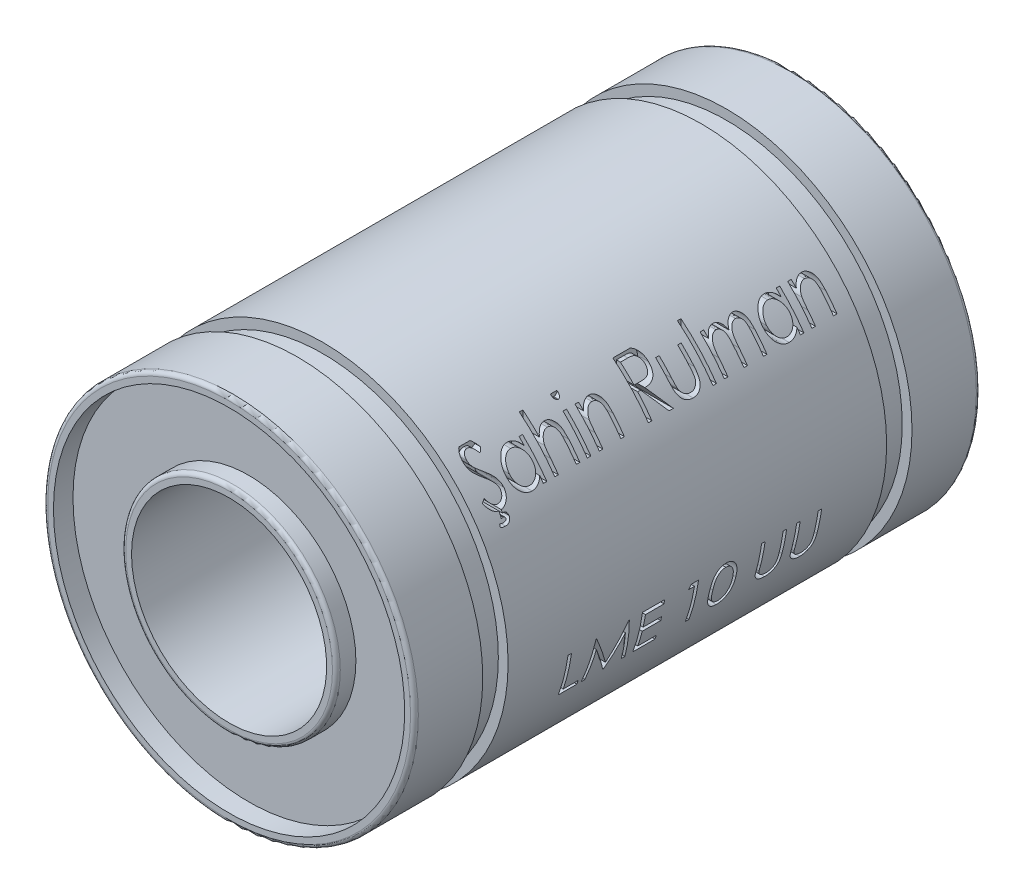
from build123d import *

# Parameters (mm, degrees)
SKETCH1_R           = 9.5
SKETCH1_R_2         = 5
BOSS_EXTRUDE1_DEPTH = 14.5
SKETCH2_W           = 1.3
SKETCH2_H           = 1.476208414
SKETCH3_W           = 0.17948718
SKETCH3_H           = 1.461538461
SKETCH3_H_2         = 2.051282051
CUT_EXTRUDE1_DEPTH  = 5
SKETCH4_R           = 9
SKETCH4_R_2         = 5.5
CUT_EXTRUDE2_DEPTH  = 1
FILLET1_R           = 0.2


with BuildPart() as part:
    # Sketch1 → Boss-Extrude1 (new, symmetric)
    with BuildSketch(Plane.XY):
        Circle(SKETCH1_R)
        Circle(SKETCH1_R_2, mode=Mode.SUBTRACT)
    extrude(amount=BOSS_EXTRUDE1_DEPTH, both=True)

    # Sketch2 → Cut-Revolve1 (revolve, cut)
    with BuildSketch(Plane(origin=(0, 0, 0), x_dir=(0, 0, -1), z_dir=(1, 0, 0))):
        with Locations((-10.35, 9.738104207)):
            Rectangle(SKETCH2_W, SKETCH2_H)
        with Locations((10.35, 9.738104207)):
            Rectangle(SKETCH2_W, SKETCH2_H)
    revolve(axis=Axis((0, 0, 17.343740467), (0, 0, -1)), mode=Mode.SUBTRACT)

    # Sketch3 → Cut-Extrude1 (cut)
    # profile 1 of 20: a face of its own
    with BuildSketch(Plane(origin=(11, 0, 0), x_dir=(0, 0, -1), z_dir=(1, 0, 0))):
        with BuildLine():
            Line((-9.059089489, 5.783097594), (-8.890018977, 5.884459774))
            add(Edge.make_bspline(
                [(-8.890018977, 5.884459774), (-8.87429427, 5.858137268), (-8.844166338, 5.807704363), (-8.793908418, 5.739556911), (-8.741832469, 5.681635679), (-8.68755285, 5.634277617), (-8.63140088, 5.596992539), (-8.573009992, 5.570591264), (-8.512576957, 5.554124992), (-8.471449059, 5.552124943), (-8.450916413, 5.55112644)],
                knots=[0, 0, 0, 0, 1.272034388, 2.437168799, 3.508375237, 4.49857839, 5.41946034, 6.295179144, 7.148887113, 8, 8, 8, 8], degree=3))
            add(Edge.make_bspline(
                [(-8.450916413, 5.55112644), (-8.433381064, 5.551614825), (-8.398617193, 5.552583048), (-8.347438769, 5.561886363), (-8.297734882, 5.576179008), (-8.250529946, 5.596648112), (-8.206475309, 5.621412961), (-8.167842912, 5.651325062), (-8.134445133, 5.684814323), (-8.107125639, 5.72217584), (-8.086165619, 5.762357068), (-8.070055865, 5.803600468), (-8.061115823, 5.846553936), (-8.059769107, 5.8754742), (-8.059089489, 5.890068748)],
                knots=[0, 0, 0, 0, 1.095163259, 2.171163733, 3.241058638, 4.321873601, 5.38011039, 6.391990106, 7.366004449, 8.327778327, 9.272591725, 10.192022065, 11.087607919, 12, 12, 12, 12], degree=3))
            add(Edge.make_bspline(
                [(-8.059089489, 5.890068748), (-8.059931953, 5.906720662), (-8.061644557, 5.94057157), (-8.076119689, 5.990514229), (-8.098890687, 6.039938555), (-8.119897912, 6.070510707), (-8.130804233, 6.086382851)],
                knots=[0, 0, 0, 0, 0.938893495, 1.908633276, 2.914225137, 4, 4, 4, 4], degree=3))
            add(Edge.make_bspline(
                [(-8.130804233, 6.086382851), (-8.13975887, 6.097838178), (-8.158558009, 6.121887206), (-8.190876588, 6.157684484), (-8.228800082, 6.194609294), (-8.271030685, 6.234071613), (-8.319106735, 6.274236068), (-8.371522458, 6.317017941), (-8.429616092, 6.360790271), (-8.470358661, 6.390146023), (-8.491381156, 6.405293107)],
                knots=[0, 0, 0, 0, 0.722233717, 1.516239348, 2.393582979, 3.351407094, 4.387010283, 5.505090956, 6.712668013, 8, 8, 8, 8], degree=3))
            add(Edge.make_bspline(
                [(-8.491381156, 6.405293107), (-8.51242344, 6.420280871), (-8.552654683, 6.448936336), (-8.60891673, 6.491464498), (-8.659227852, 6.530346709), (-8.703364433, 6.565949002), (-8.74130706, 6.598276204), (-8.773354723, 6.627017884), (-8.798691042, 6.652951347), (-8.812779945, 6.669774971), (-8.819105515, 6.677328364)],
                knots=[0, 0, 0, 0, 1.452282411, 2.77665338, 3.964542531, 5.026858415, 5.96415736, 6.766646006, 7.446254459, 8, 8, 8, 8], degree=3))
            add(Edge.make_bspline(
                [(-8.819105515, 6.677328364), (-8.827946969, 6.689100385), (-8.845334876, 6.712251644), (-8.868286879, 6.748437277), (-8.887794972, 6.785479143), (-8.903087734, 6.82347678), (-8.915965573, 6.861896739), (-8.924627248, 6.901240308), (-8.930050903, 6.941330947), (-8.930606324, 6.96831009), (-8.930884361, 6.981815543)],
                knots=[0, 0, 0, 0, 1.068054152, 2.10047183, 3.106115577, 4.101338837, 5.06977816, 6.043150881, 7.020423561, 8, 8, 8, 8], degree=3))
            add(Edge.make_bspline(
                [(-8.930884361, 6.981815543), (-8.930138528, 7.002975414), (-8.928662802, 7.044842879), (-8.916182506, 7.106003354), (-8.89648371, 7.164395592), (-8.868886631, 7.219441497), (-8.833311001, 7.269707772), (-8.792141873, 7.315772622), (-8.743106738, 7.354497526), (-8.689305239, 7.388332988), (-8.630415883, 7.414816373), (-8.568706795, 7.434794076), (-8.504079897, 7.446113652), (-8.460306677, 7.447738089), (-8.4380959, 7.448562338)],
                knots=[0, 0, 0, 0, 1.005424448, 1.989358655, 2.955360095, 3.929531133, 4.905563448, 5.876582895, 6.856512386, 7.866279853, 8.892233794, 9.918561126, 10.94386622, 12, 12, 12, 12], degree=3))
            add(Edge.make_bspline(
                [(-8.4380959, 7.448562338), (-8.414527842, 7.447749451), (-8.367658499, 7.446132879), (-8.29871609, 7.432077147), (-8.232338537, 7.40881962), (-8.178942386, 7.382426101), (-8.137152237, 7.356065292), (-8.105282104, 7.332053964), (-8.072986418, 7.304411045), (-8.040004672, 7.273062904), (-8.006895724, 7.237721904), (-7.973168037, 7.198630082), (-7.93874274, 7.156026335), (-7.916596534, 7.125612335), (-7.905243336, 7.110020671)],
                knots=[0, 0, 0, 0, 1.286793592, 2.559021753, 3.825965368, 5.121522368, 5.803751409, 6.523245864, 7.299691795, 8.125521123, 9.008227632, 9.944561021, 10.946284179, 12, 12, 12, 12], degree=3))
            Line((-7.905243336, 7.110020671), (-8.067502951, 6.987023876))
            add(Edge.make_bspline(
                [(-8.067502951, 6.987023876), (-8.077300627, 6.999645985), (-8.096168659, 7.023953216), (-8.12481408, 7.057993967), (-8.151813308, 7.089089098), (-8.178413536, 7.116097743), (-8.203209897, 7.140498962), (-8.227276778, 7.161390252), (-8.250267836, 7.178976306), (-8.279248928, 7.197744055), (-8.315659053, 7.216347771), (-8.361364502, 7.232090101), (-8.409128088, 7.241550137), (-8.441659306, 7.24280093), (-8.458127951, 7.243434133)],
                knots=[0, 0, 0, 0, 1.181633172, 2.275549214, 3.290209073, 4.226197932, 5.078386478, 5.862611352, 6.581680152, 7.217281963, 8.414376989, 9.595101626, 10.782541182, 12, 12, 12, 12], degree=3))
            add(Edge.make_bspline(
                [(-8.458127951, 7.243434133), (-8.478788821, 7.242741733), (-8.518631362, 7.241406505), (-8.575197211, 7.226823656), (-8.626108026, 7.203862593), (-8.669852349, 7.171682605), (-8.706273478, 7.133556324), (-8.732619455, 7.089682692), (-8.748476692, 7.041235605), (-8.750411709, 7.007440373), (-8.751397182, 6.990229005)],
                knots=[0, 0, 0, 0, 1.14458467, 2.207223713, 3.21896685, 4.227309161, 5.202851033, 6.127160689, 7.046193047, 8, 8, 8, 8], degree=3))
            add(Edge.make_bspline(
                [(-8.751397182, 6.990229005), (-8.751172538, 6.979513874), (-8.750722883, 6.958066091), (-8.74445157, 6.926379565), (-8.736394811, 6.894773085), (-8.723627593, 6.863388752), (-8.706001705, 6.83167769), (-8.68285589, 6.79909384), (-8.653705426, 6.765350006), (-8.631375705, 6.743402935), (-8.619586284, 6.731815543)],
                knots=[0, 0, 0, 0, 0.858281714, 1.717966888, 2.583508476, 3.4729293, 4.427298488, 5.488583878, 6.674047936, 8, 8, 8, 8], degree=3))
            add(Edge.make_bspline(
                [(-8.619586284, 6.731815543), (-8.615208357, 6.727908671), (-8.604807405, 6.718626838), (-8.58579259, 6.703431249), (-8.560682419, 6.684686808), (-8.53013259, 6.661494055), (-8.493579812, 6.634590363), (-8.451020066, 6.604319727), (-8.402927761, 6.569699465), (-8.368800952, 6.545495156), (-8.350756156, 6.532696953)],
                knots=[0, 0, 0, 0, 0.420754252, 0.999615792, 1.744751191, 2.668019286, 3.750313428, 4.999500688, 6.413464383, 8, 8, 8, 8], degree=3))
            add(Edge.make_bspline(
                [(-8.350756156, 6.532696953), (-8.32904992, 6.516901891), (-8.287018802, 6.486316941), (-8.227214471, 6.440365124), (-8.172989437, 6.395423542), (-8.124153321, 6.351779195), (-8.080223659, 6.309763142), (-8.041687819, 6.268869896), (-8.008153144, 6.229392426), (-7.972050734, 6.178779525), (-7.935160551, 6.116618906), (-7.90347969, 6.040459912), (-7.883503491, 5.964004872), (-7.880891197, 5.912618108), (-7.87960231, 5.887264261)],
                knots=[0, 0, 0, 0, 1.163667725, 2.253281268, 3.268753668, 4.215851969, 5.092017293, 5.902905408, 6.650798638, 7.335211899, 8.59617414, 9.77448103, 10.901945474, 12, 12, 12, 12], degree=3))
            add(Edge.make_bspline(
                [(-7.87960231, 5.887264261), (-7.879977817, 5.869333767), (-7.88072154, 5.833820976), (-7.889270634, 5.781675218), (-7.901796157, 5.731029007), (-7.920674576, 5.682508371), (-7.943716381, 5.635225649), (-7.972954237, 5.590421135), (-8.006844342, 5.547103193), (-8.04572078, 5.506426912), (-8.088261295, 5.469086229), (-8.133223406, 5.435869622), (-8.180680705, 5.408173437), (-8.230375743, 5.385572956), (-8.282319936, 5.36789666), (-8.336495812, 5.355089307), (-8.392992676, 5.3472289), (-8.431392951, 5.346413037), (-8.450916413, 5.345998235)],
                knots=[0, 0, 0, 0, 0.983748083, 1.948392443, 2.894712957, 3.844097841, 4.80183111, 5.778335162, 6.776009319, 7.81870978, 8.863265674, 9.881300176, 10.883814829, 11.87499822, 12.874611388, 13.892143829, 14.928324115, 16, 16, 16, 16], degree=3))
            add(Edge.make_bspline(
                [(-8.450916413, 5.345998235), (-8.466022323, 5.346290339), (-8.4960439, 5.346870868), (-8.540449318, 5.352003028), (-8.583957655, 5.35926423), (-8.626022959, 5.37079227), (-8.667187194, 5.384779114), (-8.707271328, 5.402001019), (-8.746294787, 5.422639419), (-8.784476263, 5.446236576), (-8.821718649, 5.473698145), (-8.857672631, 5.505683), (-8.893517879, 5.541309003), (-8.928196392, 5.58154361), (-8.962409617, 5.6257368), (-8.995482994, 5.674302048), (-9.028101118, 5.726974822), (-9.0485671, 5.764040585), (-9.059089489, 5.783097594)],
                knots=[0, 0, 0, 0, 0.915332311, 1.819136955, 2.706846663, 3.586547465, 4.459518054, 5.340707479, 6.227863349, 7.133153174, 8.059268498, 9.028702269, 10.047606654, 11.120612155, 12.245963614, 13.433783089, 14.680604001, 16, 16, 16, 16], degree=3))
        make_face()
    # profile 2 of 20: a face of its own
    with BuildSketch(Plane(origin=(11, 0, 0), x_dir=(0, 0, -1), z_dir=(1, 0, 0))):
        with BuildLine():
            Line((-8.520627951, 5.397280287), (-8.392422823, 5.397280287))
            Line((-8.392422823, 5.397280287), (-8.415660002, 5.239427722))
            add(Edge.make_bspline(
                [(-8.415660002, 5.239427722), (-8.405658129, 5.240700116), (-8.387430402, 5.243018965), (-8.369061669, 5.243305035), (-8.360772182, 5.243434133)],
                knots=[0, 0, 0, 0, 1.097435133, 2, 2, 2, 2], degree=3))
            add(Edge.make_bspline(
                [(-8.360772182, 5.243434133), (-8.348828062, 5.242966182), (-8.32565431, 5.242058273), (-8.292502701, 5.232957756), (-8.262576343, 5.217769655), (-8.236330261, 5.197029031), (-8.21467439, 5.171852596), (-8.198613427, 5.143330841), (-8.189067253, 5.111549782), (-8.187897294, 5.089386353), (-8.187294618, 5.077969389)],
                knots=[0, 0, 0, 0, 1.069289879, 2.074615601, 3.054870152, 4.061265559, 5.055109668, 6.014880684, 6.977412992, 8, 8, 8, 8], degree=3))
            add(Edge.make_bspline(
                [(-8.187294618, 5.077969389), (-8.188214283, 5.061403216), (-8.190025253, 5.028781752), (-8.2070389, 4.982151076), (-8.234821546, 4.939959009), (-8.266060032, 4.909235967), (-8.295255922, 4.887163361), (-8.319953161, 4.87256588), (-8.346957581, 4.860715325), (-8.376018325, 4.850621086), (-8.407226874, 4.842632865), (-8.440729941, 4.837047477), (-8.476364613, 4.833938785), (-8.500857085, 4.833435697), (-8.513416413, 4.833177722)],
                knots=[0, 0, 0, 0, 1.304321605, 2.568419278, 3.86418674, 5.26606471, 6.004250022, 6.751196373, 7.525339837, 8.3290844, 9.178243098, 10.065883961, 11.008217871, 12, 12, 12, 12], degree=3))
            add(Edge.make_bspline(
                [(-8.513416413, 4.833177722), (-8.53427493, 4.833594148), (-8.575467591, 4.834416532), (-8.636192803, 4.842323496), (-8.694976851, 4.8549028), (-8.732664804, 4.867420622), (-8.751397182, 4.873642466)],
                knots=[0, 0, 0, 0, 1.031353521, 2.036779262, 3.024202981, 4, 4, 4, 4], degree=3))
            Line((-8.751397182, 4.873642466), (-8.720948464, 4.98862644))
            add(Edge.make_bspline(
                [(-8.720948464, 4.98862644), (-8.706450864, 4.984378246), (-8.678095942, 4.976069476), (-8.63556268, 4.967961858), (-8.594501975, 4.962235524), (-8.567521741, 4.961663539), (-8.554281797, 4.961382851)],
                knots=[0, 0, 0, 0, 1.069011577, 2.090810949, 3.06310831, 4, 4, 4, 4], degree=3))
            add(Edge.make_bspline(
                [(-8.554281797, 4.961382851), (-8.538232026, 4.961574228), (-8.508569819, 4.961927921), (-8.46809508, 4.967248083), (-8.434844779, 4.974501994), (-8.409228703, 4.986335198), (-8.390119712, 5.00054077), (-8.37670948, 5.016759877), (-8.36799366, 5.034699621), (-8.367183067, 5.047563084), (-8.366781797, 5.053930928)],
                knots=[0, 0, 0, 0, 1.662562782, 3.072646979, 4.227938229, 5.175724612, 5.976100332, 6.674653651, 7.343909363, 8, 8, 8, 8], degree=3))
            add(Edge.make_bspline(
                [(-8.366781797, 5.053930928), (-8.36709684, 5.057983642), (-8.367715365, 5.065940337), (-8.372576558, 5.0773835), (-8.380398356, 5.087902078), (-8.391230964, 5.097362323), (-8.404524434, 5.105306166), (-8.420110165, 5.111651303), (-8.438266128, 5.114445533), (-8.451045292, 5.114959999), (-8.45772731, 5.115229005)],
                knots=[0, 0, 0, 0, 0.799131153, 1.568934487, 2.41921006, 3.373050169, 4.391917585, 5.470612156, 6.677423946, 8, 8, 8, 8], degree=3))
            add(Edge.make_bspline(
                [(-8.45772731, 5.115229005), (-8.46414364, 5.115048854), (-8.478347653, 5.114650049), (-8.50130283, 5.111922654), (-8.528094905, 5.108513741), (-8.546956364, 5.104802388), (-8.557086284, 5.102809133)],
                knots=[0, 0, 0, 0, 0.767927036, 1.69998198, 2.764729826, 4, 4, 4, 4], degree=3))
            Line((-8.557086284, 5.102809133), (-8.520627951, 5.397280287))
        make_face()
    # profile 3 of 20: a face of its own
    with BuildSketch(Plane(origin=(11, 0, 0), x_dir=(0, 0, -1), z_dir=(1, 0, 0))):
        with BuildLine():
            Line((-6.033448464, 6.858818748), (-6.033448464, 5.397280287))
            Line((-6.033448464, 5.397280287), (-6.212935643, 5.397280287))
            Line((-6.212935643, 5.397280287), (-6.212935643, 5.650084774))
            add(Edge.make_bspline(
                [(-6.212935643, 5.650084774), (-6.233174952, 5.627205006), (-6.272672218, 5.582554851), (-6.338638571, 5.524222181), (-6.408563244, 5.476005997), (-6.482106856, 5.437063188), (-6.559202995, 5.407810585), (-6.63968076, 5.387018494), (-6.723572977, 5.373650588), (-6.780860037, 5.372315718), (-6.809890771, 5.371639261)],
                knots=[0, 0, 0, 0, 1.074387032, 2.096679803, 3.090159297, 4.057316773, 5.018401886, 5.985159533, 6.978961417, 8, 8, 8, 8], degree=3))
            add(Edge.make_bspline(
                [(-6.809890771, 5.371639261), (-6.835701031, 5.372340045), (-6.886600005, 5.373722022), (-6.961473763, 5.384443339), (-7.033526477, 5.401660837), (-7.102826233, 5.425604202), (-7.168924602, 5.457364672), (-7.232387514, 5.495388242), (-7.292886196, 5.540668716), (-7.349498504, 5.592433304), (-7.401631075, 5.648659011), (-7.447380374, 5.708627895), (-7.485524991, 5.77208064), (-7.51742218, 5.838213871), (-7.54199152, 5.907536682), (-7.559119311, 5.979809349), (-7.569828137, 6.05494642), (-7.571209543, 6.106111862), (-7.571910002, 6.132055928)],
                knots=[0, 0, 0, 0, 1.033919861, 2.038935746, 3.024066025, 3.998881131, 4.97069526, 5.957263378, 6.95902576, 7.993208707, 9.027059324, 10.027763471, 11.009749337, 11.988697705, 12.965288445, 13.950418724, 14.960734635, 16, 16, 16, 16], degree=3))
            add(Edge.make_bspline(
                [(-7.571910002, 6.132055928), (-7.571194019, 6.157463758), (-7.569778558, 6.207693669), (-7.55923386, 6.28156721), (-7.541501856, 6.352720502), (-7.516617371, 6.42092447), (-7.484707683, 6.486261641), (-7.445891633, 6.548778227), (-7.400166419, 6.608646454), (-7.347450758, 6.664458584), (-7.290345175, 6.71601322), (-7.229254471, 6.760818389), (-7.165698311, 6.799513731), (-7.098690876, 6.830172861), (-7.029223959, 6.854978063), (-6.956679133, 6.872139759), (-6.881358231, 6.882252514), (-6.830220807, 6.883716951), (-6.804281797, 6.884459774)],
                knots=[0, 0, 0, 0, 1.020392517, 2.01726096, 2.990465484, 3.961182959, 4.928053699, 5.906110375, 6.912531644, 7.948652711, 8.985773172, 9.998621852, 10.987621588, 11.969261332, 12.953316658, 13.946091881, 14.958173133, 16, 16, 16, 16], degree=3))
            add(Edge.make_bspline(
                [(-6.804281797, 6.884459774), (-6.774453306, 6.883638201), (-6.715961043, 6.882027137), (-6.630402181, 6.868619864), (-6.549462479, 6.845969312), (-6.472517135, 6.815159313), (-6.399842457, 6.774217182), (-6.332126466, 6.72257149), (-6.268660476, 6.660547954), (-6.231871738, 6.6129077), (-6.212935643, 6.588386056)],
                knots=[0, 0, 0, 0, 1.038897134, 2.037228247, 3.008116434, 3.962042015, 4.918381754, 5.904844433, 6.921570401, 8, 8, 8, 8], degree=3))
            Line((-6.212935643, 6.588386056), (-6.212935643, 6.858818748))
            Line((-6.212935643, 6.858818748), (-6.033448464, 6.858818748))
        make_face()
        with BuildLine():
            add(Edge.make_bspline(
                [(-6.801877951, 6.704972594), (-6.828114715, 6.704039087), (-6.879901915, 6.702196492), (-6.955927059, 6.687811638), (-7.028677582, 6.663877584), (-7.097789624, 6.631145069), (-7.162171462, 6.589985791), (-7.219710703, 6.540202143), (-7.270877961, 6.483152421), (-7.313911255, 6.419094072), (-7.348991539, 6.350420877), (-7.373658414, 6.278635484), (-7.389926555, 6.20503264), (-7.391588567, 6.155111105), (-7.392422823, 6.130052722)],
                knots=[0, 0, 0, 0, 1.031046209, 2.035121221, 3.029706178, 4.034933723, 5.034054252, 6.02443088, 7.017295772, 8.038157696, 9.050218397, 10.03989886, 11.016116709, 12, 12, 12, 12], degree=3))
            add(Edge.make_bspline(
                [(-7.392422823, 6.130052722), (-7.391357169, 6.10514409), (-7.38923004, 6.055424458), (-7.373943929, 5.981721271), (-7.348298287, 5.909918961), (-7.313302822, 5.840626965), (-7.269481894, 5.776293193), (-7.218688378, 5.718155981), (-7.160431075, 5.66816193), (-7.095901071, 5.626311888), (-7.02698223, 5.592504733), (-6.954505698, 5.568981511), (-6.879833905, 5.553794207), (-6.829061143, 5.552020221), (-6.803480515, 5.55112644)],
                knots=[0, 0, 0, 0, 0.979072187, 1.954306742, 2.945804271, 3.96968567, 4.997920485, 5.998718438, 6.996577872, 8.005894225, 9.015743152, 10.005417472, 10.995077863, 12, 12, 12, 12], degree=3))
            add(Edge.make_bspline(
                [(-6.803480515, 5.55112644), (-6.777511085, 5.552074991), (-6.725860464, 5.553961565), (-6.649609774, 5.568408002), (-6.575612652, 5.592275887), (-6.504877093, 5.625361102), (-6.438982161, 5.666365305), (-6.379840517, 5.714369357), (-6.329831392, 5.770199748), (-6.287435615, 5.831557722), (-6.25419252, 5.89882172), (-6.229977629, 5.970441257), (-6.215661111, 6.046418827), (-6.213856694, 6.098341071), (-6.212935643, 6.124844389)],
                knots=[0, 0, 0, 0, 1.01762866, 2.023962475, 3.030623092, 4.058876274, 5.077231937, 6.066672613, 7.034107872, 8.005628644, 8.981990164, 9.965428785, 10.961468474, 12, 12, 12, 12], degree=3))
            add(Edge.make_bspline(
                [(-6.212935643, 6.124844389), (-6.213484018, 6.145037435), (-6.214563394, 6.18478374), (-6.222809434, 6.243142321), (-6.235926535, 6.298990165), (-6.25441006, 6.352385987), (-6.278690794, 6.403034567), (-6.307975232, 6.451299573), (-6.342778346, 6.49692998), (-6.382539887, 6.539297449), (-6.42606286, 6.577941142), (-6.472116883, 6.612434993), (-6.521247595, 6.640771435), (-6.572628759, 6.66422359), (-6.626349522, 6.682885961), (-6.682847019, 6.695336072), (-6.741520726, 6.703884827), (-6.781547043, 6.704606188), (-6.801877951, 6.704972594)],
                knots=[0, 0, 0, 0, 1.050140795, 2.067009409, 3.05949893, 4.030605086, 5.00011959, 5.97591094, 6.962425594, 7.979863591, 8.993523472, 9.986985069, 10.967611495, 11.937549037, 12.921786183, 13.919465291, 14.943216303, 16, 16, 16, 16], degree=3))
        make_face(mode=Mode.SUBTRACT)
    # profile 4 of 20: a face of its own
    with BuildSketch(Plane(origin=(11, 0, 0), x_dir=(0, 0, -1), z_dir=(1, 0, 0))):
        with BuildLine():
            Line((-5.623192054, 7.448562338), (-5.443704874, 7.448562338))
            Line((-5.443704874, 7.448562338), (-5.443704874, 6.582777081))
            add(Edge.make_bspline(
                [(-5.443704874, 6.582777081), (-5.424437845, 6.606859357), (-5.386923951, 6.653748781), (-5.323783313, 6.714926605), (-5.258942814, 6.767954388), (-5.190162923, 6.810166078), (-5.118705483, 6.843512674), (-5.044269115, 6.867162758), (-4.966839988, 6.881706242), (-4.914254188, 6.883533909), (-4.88761513, 6.884459774)],
                knots=[0, 0, 0, 0, 1.125788106, 2.19196713, 3.20547328, 4.180437432, 5.132270164, 6.079753143, 7.027236121, 8, 8, 8, 8], degree=3))
            add(Edge.make_bspline(
                [(-4.88761513, 6.884459774), (-4.860569192, 6.883462385), (-4.807633766, 6.881510255), (-4.730558644, 6.866074037), (-4.658581001, 6.839698358), (-4.591914805, 6.803602915), (-4.532014979, 6.758647014), (-4.47895797, 6.706743287), (-4.435620371, 6.646586762), (-4.406135161, 6.59101176), (-4.386950357, 6.541561043), (-4.374806456, 6.499140179), (-4.364509771, 6.451870514), (-4.355538494, 6.399776382), (-4.349559304, 6.342607712), (-4.344756665, 6.280622424), (-4.341341549, 6.213824071), (-4.341209203, 6.167583928), (-4.341140771, 6.143674517)],
                knots=[0, 0, 0, 0, 1.235656852, 2.418478516, 3.575258207, 4.727955599, 5.870717718, 6.98870536, 8.107142894, 9.245821548, 9.854588956, 10.528768408, 11.260415777, 12.065282286, 12.943670737, 13.886611085, 14.907229059, 16, 16, 16, 16], degree=3))
            Line((-4.341140771, 6.143674517), (-4.341140771, 5.397280287))
            Line((-4.341140771, 5.397280287), (-4.520627951, 5.397280287))
            Line((-4.520627951, 5.397280287), (-4.520627951, 6.084780287))
            add(Edge.make_bspline(
                [(-4.520627951, 6.084780287), (-4.520736696, 6.104678955), (-4.520944706, 6.142741721), (-4.521632331, 6.19723664), (-4.523167311, 6.246663003), (-4.525647783, 6.290862404), (-4.52825653, 6.329896463), (-4.531846997, 6.363708494), (-4.536024274, 6.392344937), (-4.539777863, 6.409581867), (-4.541461284, 6.417312338)],
                knots=[0, 0, 0, 0, 1.430932559, 2.737130458, 3.918967929, 4.986496826, 5.920444988, 6.731744033, 7.431208747, 8, 8, 8, 8], degree=3))
            add(Edge.make_bspline(
                [(-4.541461284, 6.417312338), (-4.547989424, 6.439994774), (-4.560539736, 6.483601626), (-4.589710008, 6.542837289), (-4.626143729, 6.593342855), (-4.670627878, 6.634436734), (-4.722375515, 6.666671899), (-4.781724066, 6.688996346), (-4.848114962, 6.702852187), (-4.894887232, 6.704246075), (-4.919265771, 6.704972594)],
                knots=[0, 0, 0, 0, 1.090059168, 2.095632401, 3.037101401, 3.955032261, 4.878929692, 5.839099886, 6.873700383, 8, 8, 8, 8], degree=3))
            add(Edge.make_bspline(
                [(-4.919265771, 6.704972594), (-4.933704499, 6.704700694), (-4.962278368, 6.704162609), (-5.004649034, 6.698760381), (-5.045751356, 6.689932542), (-5.085981172, 6.677987091), (-5.124485856, 6.661732499), (-5.162387756, 6.642915248), (-5.198613018, 6.619881959), (-5.233804914, 6.594038664), (-5.26655779, 6.565427373), (-5.297030427, 6.535229113), (-5.324195193, 6.50307199), (-5.348805817, 6.469471924), (-5.370050551, 6.433968042), (-5.38859517, 6.396902717), (-5.404329853, 6.358227205), (-5.412148535, 6.331384313), (-5.416060643, 6.317953364)],
                knots=[0, 0, 0, 0, 1.024319606, 2.027102035, 3.025350316, 4.005802111, 5.00026367, 5.987881639, 7.005602596, 8.042517216, 9.083927026, 10.089214625, 11.084353441, 12.06828073, 13.041928858, 14.016821737, 15.00770877, 16, 16, 16, 16], degree=3))
            add(Edge.make_bspline(
                [(-5.416060643, 6.317953364), (-5.418311745, 6.308227106), (-5.423217171, 6.287032393), (-5.428539933, 6.252075637), (-5.433304388, 6.211454853), (-5.437332131, 6.165231653), (-5.439802466, 6.113236657), (-5.442464318, 6.05582468), (-5.443455183, 5.992636097), (-5.443619156, 5.948695807), (-5.443704874, 5.925725799)],
                knots=[0, 0, 0, 0, 0.607992626, 1.324890765, 2.152360218, 3.099583803, 4.150613268, 5.323148443, 6.60066238, 8, 8, 8, 8], degree=3))
            Line((-5.443704874, 5.925725799), (-5.443704874, 5.397280287))
            Line((-5.443704874, 5.397280287), (-5.623192054, 5.397280287))
            Line((-5.623192054, 5.397280287), (-5.623192054, 7.448562338))
        make_face()
    # profile 5 of 20: a face of its own
    with BuildSketch(Plane(origin=(11, 0, 0), x_dir=(0, 0, -1), z_dir=(1, 0, 0))):
        with BuildLine():
            add(Edge.make_bspline(
                [(-3.867583079, 7.474203364), (-3.856445184, 7.473686705), (-3.834635047, 7.472674988), (-3.803096037, 7.464011287), (-3.774377745, 7.449325753), (-3.748904754, 7.429623078), (-3.727046533, 7.406451967), (-3.71174327, 7.3794457), (-3.701907615, 7.350269335), (-3.70071987, 7.329917855), (-3.70011513, 7.319555928)],
                knots=[0, 0, 0, 0, 1.055194115, 2.066272739, 3.074728998, 4.095836921, 5.109056067, 6.073838105, 7.019297344, 8, 8, 8, 8], degree=3))
            add(Edge.make_bspline(
                [(-3.70011513, 7.319555928), (-3.700733507, 7.309462983), (-3.701955966, 7.289510426), (-3.711735673, 7.26083987), (-3.727176952, 7.234208851), (-3.748890738, 7.211082731), (-3.774381459, 7.191390948), (-3.803095051, 7.176702526), (-3.834635307, 7.16803959), (-3.856445272, 7.167027768), (-3.867583079, 7.166511056)],
                knots=[0, 0, 0, 0, 0.96129708, 1.900370562, 2.859976407, 3.87933698, 4.906634145, 5.921202961, 6.938410037, 8, 8, 8, 8], degree=3))
            add(Edge.make_bspline(
                [(-3.867583079, 7.166511056), (-3.878593522, 7.167008039), (-3.900023911, 7.167975351), (-3.931090678, 7.176872504), (-3.9595641, 7.191395975), (-3.98508677, 7.210953795), (-4.006361167, 7.234350879), (-4.021845924, 7.260823618), (-4.031603045, 7.289514564), (-4.032828547, 7.309464373), (-4.033448464, 7.319555928)],
                knots=[0, 0, 0, 0, 1.054934014, 2.053291228, 3.073705704, 4.106921865, 5.123545215, 6.088680038, 7.033164197, 8, 8, 8, 8], degree=3))
            add(Edge.make_bspline(
                [(-4.033448464, 7.319555928), (-4.032842129, 7.329916413), (-4.031651248, 7.35026506), (-4.02183861, 7.379462222), (-4.006490149, 7.406308794), (-3.985072684, 7.429751937), (-3.959567849, 7.449320757), (-3.931089709, 7.463841318), (-3.900024167, 7.472739226), (-3.878593609, 7.473706434), (-3.867583079, 7.474203364)],
                knots=[0, 0, 0, 0, 0.98631895, 1.937192651, 2.907499808, 3.917963147, 4.944918757, 5.95915025, 6.951458133, 8, 8, 8, 8], degree=3))
        make_face()
    # profile 6 of 20: a face of its own
    with BuildSketch(Plane(origin=(11, 0, 0), x_dir=(0, 0, -1), z_dir=(1, 0, 0))):
        with Locations((-3.866781797, 6.128049518)):
            Rectangle(SKETCH3_W, SKETCH3_H)
    # profile 7 of 20: a face of its own
    with BuildSketch(Plane(origin=(11, 0, 0), x_dir=(0, 0, -1), z_dir=(1, 0, 0))):
        with BuildLine():
            Line((-3.341140771, 6.858818748), (-3.161653592, 6.858818748))
            Line((-3.161653592, 6.858818748), (-3.161653592, 6.595196953))
            add(Edge.make_bspline(
                [(-3.161653592, 6.595196953), (-3.142489229, 6.619107081), (-3.105300114, 6.665505517), (-3.043366209, 6.726488702), (-2.977912552, 6.776743117), (-2.909339979, 6.816802427), (-2.837555401, 6.8470005), (-2.76299639, 6.868809603), (-2.685216558, 6.881886648), (-2.632322594, 6.883595351), (-2.605563848, 6.884459774)],
                knots=[0, 0, 0, 0, 1.12780773, 2.188550248, 3.19190651, 4.159438251, 5.104880172, 6.052711206, 7.014878035, 8, 8, 8, 8], degree=3))
            add(Edge.make_bspline(
                [(-2.605563848, 6.884459774), (-2.578517772, 6.883462519), (-2.525582076, 6.881510652), (-2.448508898, 6.866072542), (-2.376524102, 6.839703825), (-2.309884355, 6.803582642), (-2.249811662, 6.758664657), (-2.197054604, 6.706334496), (-2.153418463, 6.646142449), (-2.124162827, 6.590300645), (-2.104891028, 6.540764191), (-2.092758264, 6.498337477), (-2.082454846, 6.451069962), (-2.073522418, 6.399104482), (-2.067478354, 6.342076945), (-2.062711331, 6.280221121), (-2.059294934, 6.213557047), (-2.059159387, 6.167450402), (-2.059089489, 6.143674517)],
                knots=[0, 0, 0, 0, 1.235846778, 2.418850247, 3.575807741, 4.728682307, 5.871620074, 6.994088408, 8.11269785, 9.256955736, 9.865816715, 10.540099792, 11.271859618, 12.076849838, 12.949306005, 13.892391288, 14.913166135, 16, 16, 16, 16], degree=3))
            Line((-2.059089489, 6.143674517), (-2.059089489, 5.397280287))
            Line((-2.059089489, 5.397280287), (-2.238576669, 5.397280287))
            Line((-2.238576669, 5.397280287), (-2.238576669, 6.084780287))
            add(Edge.make_bspline(
                [(-2.238576669, 6.084780287), (-2.238687073, 6.104678827), (-2.238898259, 6.142741347), (-2.239564342, 6.197237932), (-2.241169946, 6.246658834), (-2.243426125, 6.290885901), (-2.246728428, 6.329876664), (-2.250169932, 6.363710537), (-2.25437849, 6.392344561), (-2.258128726, 6.409581751), (-2.259810643, 6.417312338)],
                knots=[0, 0, 0, 0, 1.430800155, 2.736877192, 3.918605307, 4.986035426, 5.920637409, 6.731861385, 7.431261377, 8, 8, 8, 8], degree=3))
            add(Edge.make_bspline(
                [(-2.259810643, 6.417312338), (-2.265882376, 6.440004444), (-2.277568582, 6.483679726), (-2.306445143, 6.542922213), (-2.34291039, 6.593321178), (-2.387423446, 6.634565019), (-2.439554347, 6.66666264), (-2.499158428, 6.688933471), (-2.565660509, 6.702862768), (-2.612434442, 6.7042497), (-2.636813848, 6.704972594)],
                knots=[0, 0, 0, 0, 1.084156227, 2.086665306, 3.027808233, 3.945421172, 4.874247719, 5.839848303, 6.874090471, 8, 8, 8, 8], degree=3))
            add(Edge.make_bspline(
                [(-2.636813848, 6.704972594), (-2.651252525, 6.704700592), (-2.679826292, 6.704162305), (-2.722197705, 6.698761564), (-2.763297232, 6.68992816), (-2.803537352, 6.678003225), (-2.842113234, 6.661624785), (-2.880264257, 6.643036574), (-2.916553837, 6.619866167), (-2.951755778, 6.594042955), (-2.984505954, 6.565426265), (-3.01497929, 6.535229402), (-3.042143873, 6.503071914), (-3.066754545, 6.469471944), (-3.087999267, 6.433968036), (-3.106543888, 6.396902718), (-3.122278571, 6.358227205), (-3.130097252, 6.331384313), (-3.134009361, 6.317953364)],
                knots=[0, 0, 0, 0, 1.023777757, 2.026029729, 3.023749952, 4.003683103, 4.997618607, 5.993177895, 7.010360494, 8.046726602, 9.087585522, 10.09234134, 11.086953743, 12.070360549, 13.043493632, 14.017870808, 15.008233677, 16, 16, 16, 16], degree=3))
            add(Edge.make_bspline(
                [(-3.134009361, 6.317953364), (-3.136260589, 6.308093247), (-3.141161394, 6.286628291), (-3.14645464, 6.251402908), (-3.151258968, 6.210654351), (-3.155280088, 6.16443017), (-3.157740326, 6.112568527), (-3.160422838, 6.055290905), (-3.161399444, 5.992368912), (-3.161566504, 5.94856223), (-3.161653592, 5.925725799)],
                knots=[0, 0, 0, 0, 0.615963638, 1.340920617, 2.168419149, 3.115676021, 4.16674242, 5.331190069, 6.6087489, 8, 8, 8, 8], degree=3))
            Line((-3.161653592, 5.925725799), (-3.161653592, 5.397280287))
            Line((-3.161653592, 5.397280287), (-3.341140771, 5.397280287))
            Line((-3.341140771, 5.397280287), (-3.341140771, 6.858818748))
        make_face()
    # profile 8 of 20: a face of its own
    with BuildSketch(Plane(origin=(11, 0, 0), x_dir=(0, 0, -1), z_dir=(1, 0, 0))):
        with BuildLine():
            Line((-0.828320259, 7.397280287), (-0.428079874, 7.397280287))
            add(Edge.make_bspline(
                [(-0.428079874, 7.397280287), (-0.401370658, 7.39719138), (-0.350086004, 7.39702067), (-0.276615564, 7.396068806), (-0.209857222, 7.393340603), (-0.149845886, 7.390992841), (-0.096582654, 7.386711731), (-0.049904202, 7.382619933), (-0.010025518, 7.377263555), (0.014114968, 7.372289028), (0.025045126, 7.370036697)],
                knots=[0, 0, 0, 0, 1.410062039, 2.707475311, 3.878576406, 4.937260626, 5.877586885, 6.699081471, 7.410979367, 8, 8, 8, 8], degree=3))
            add(Edge.make_bspline(
                [(0.025045126, 7.370036697), (0.039677483, 7.366421402), (0.068630048, 7.359267937), (0.1103158, 7.344148165), (0.150038271, 7.326651237), (0.187632456, 7.30610054), (0.222910051, 7.282343523), (0.2562348, 7.25579031), (0.287757922, 7.226586192), (0.316204568, 7.193994854), (0.343026883, 7.159802563), (0.365648955, 7.122828988), (0.385149801, 7.084165258), (0.400675811, 7.043418162), (0.41317751, 7.000982864), (0.421992504, 6.95647498), (0.427278897, 6.91009728), (0.4278171, 6.878464189), (0.428089998, 6.862424517)],
                knots=[0, 0, 0, 0, 1.027469482, 2.033020251, 3.019912614, 3.986113645, 4.951240523, 5.91722682, 6.890402269, 7.87763091, 8.8651537, 9.85103654, 10.82876324, 11.815024772, 12.821070561, 13.842952187, 14.906261191, 16, 16, 16, 16], degree=3))
            add(Edge.make_bspline(
                [(0.428089998, 6.862424517), (0.42725057, 6.835775886), (0.42561263, 6.783777504), (0.410341142, 6.708314144), (0.385325988, 6.63792025), (0.350855537, 6.572684457), (0.306958694, 6.513878373), (0.25420167, 6.462226685), (0.192555035, 6.419003878), (0.135166855, 6.389030846), (0.084473026, 6.369834898), (0.042739705, 6.356328408), (-0.002784283, 6.345892999), (-0.051662759, 6.336544352), (-0.104099134, 6.329486241), (-0.159967728, 6.324316759), (-0.219308386, 6.321085874), (-0.260073569, 6.320604728), (-0.281044618, 6.32035721)],
                knots=[0, 0, 0, 0, 1.260483769, 2.459530307, 3.627416485, 4.787058657, 5.939039949, 7.08810263, 8.267026773, 9.491475466, 10.141966685, 10.831826277, 11.566392101, 12.351337768, 13.187381173, 14.07005841, 15.007169909, 16, 16, 16, 16], degree=3))
            Line((-0.281044618, 6.32035721), (0.453731023, 5.397280287))
            Line((0.453731023, 5.397280287), (0.231775895, 5.397280287))
            Line((0.231775895, 5.397280287), (-0.502999746, 6.32035721))
            Line((-0.502999746, 6.32035721), (-0.648833079, 6.32035721))
            Line((-0.648833079, 6.32035721), (-0.648833079, 5.397280287))
            Line((-0.648833079, 5.397280287), (-0.828320259, 5.397280287))
            Line((-0.828320259, 5.397280287), (-0.828320259, 7.397280287))
        make_face()
        with BuildLine():
            Line((-0.648833079, 7.192152081), (-0.648833079, 6.525485415))
            Line((-0.648833079, 6.525485415), (-0.282647182, 6.522680928))
            add(Edge.make_bspline(
                [(-0.282647182, 6.522680928), (-0.265550017, 6.522673364), (-0.232410841, 6.522658703), (-0.184467604, 6.524940861), (-0.13982754, 6.527537043), (-0.098661396, 6.531508097), (-0.060950782, 6.536625853), (-0.026714546, 6.543027558), (0.004103198, 6.550485879), (0.04004522, 6.562029666), (0.080180381, 6.580318819), (0.123798358, 6.606927675), (0.160942551, 6.640395743), (0.192324187, 6.67866629), (0.217541005, 6.720744146), (0.235319322, 6.766124929), (0.246600717, 6.813662985), (0.247931315, 6.846336189), (0.248602818, 6.862825158)],
                knots=[0, 0, 0, 0, 1.146690395, 2.22261258, 3.21895312, 4.145990853, 4.996080663, 5.770904154, 6.481378293, 7.121626537, 8.300444488, 9.431385265, 10.535395872, 11.636531494, 12.74115979, 13.810798291, 14.895190096, 16, 16, 16, 16], degree=3))
            add(Edge.make_bspline(
                [(0.248602818, 6.862825158), (0.247915892, 6.878908915), (0.246554655, 6.910781051), (0.235441073, 6.957441571), (0.21664714, 7.001479829), (0.191320147, 7.042716677), (0.160463487, 7.080148526), (0.12428188, 7.112175471), (0.083764626, 7.138603736), (0.045895369, 7.155491954), (0.012047248, 7.165846156), (-0.017341129, 7.173132535), (-0.050547688, 7.178986517), (-0.087733664, 7.183676838), (-0.12874031, 7.187708234), (-0.173774968, 7.190423536), (-0.222538843, 7.192031459), (-0.256337089, 7.192110938), (-0.273833079, 7.192152081)],
                knots=[0, 0, 0, 0, 1.101028733, 2.181837193, 3.264309656, 4.369019818, 5.486613113, 6.575447106, 7.666700264, 8.788928104, 9.402425223, 10.0903467, 10.862060571, 11.710948788, 12.657782767, 13.684531032, 14.801375019, 16, 16, 16, 16], degree=3))
            Line((-0.273833079, 7.192152081), (-0.648833079, 7.192152081))
        make_face(mode=Mode.SUBTRACT)
    # profile 9 of 20: a face of its own
    with BuildSketch(Plane(origin=(11, 0, 0), x_dir=(0, 0, -1), z_dir=(1, 0, 0))):
        with BuildLine():
            Line((0.787064357, 6.858818748), (0.966551536, 6.858818748))
            Line((0.966551536, 6.858818748), (0.966551536, 6.180934133))
            add(Edge.make_bspline(
                [(0.966551536, 6.180934133), (0.966632625, 6.161035419), (0.966787743, 6.122970111), (0.96783971, 6.068195719), (0.970314049, 6.018243312), (0.973407663, 5.973084034), (0.977386026, 5.932725524), (0.982119375, 5.897308749), (0.987409902, 5.866432072), (0.992588595, 5.847835869), (0.994997049, 5.839187338)],
                knots=[0, 0, 0, 0, 1.388932606, 2.656963016, 3.823490214, 4.879454478, 5.816252168, 6.653371382, 7.373723809, 8, 8, 8, 8], degree=3))
            add(Edge.make_bspline(
                [(0.994997049, 5.839187338), (0.998860738, 5.828317126), (1.00650779, 5.806802691), (1.020378352, 5.775723259), (1.037537401, 5.746937384), (1.056314446, 5.719335056), (1.07797125, 5.693733921), (1.102233805, 5.67017721), (1.12828994, 5.647774873), (1.167007097, 5.621269277), (1.219955249, 5.592860517), (1.289471109, 5.568348621), (1.364844952, 5.553699581), (1.416939078, 5.552000007), (1.443714998, 5.55112644)],
                knots=[0, 0, 0, 0, 0.725840625, 1.436591201, 2.137033971, 2.831655856, 3.53531722, 4.242432219, 4.957935707, 5.694543706, 7.190802206, 8.724350549, 10.316345118, 12, 12, 12, 12], degree=3))
            add(Edge.make_bspline(
                [(1.443714998, 5.55112644), (1.470488431, 5.552018582), (1.52229007, 5.553744712), (1.596835766, 5.567906734), (1.664979432, 5.591567128), (1.726037118, 5.624599935), (1.779731884, 5.665023971), (1.824477266, 5.712457576), (1.861395697, 5.765400082), (1.877515366, 5.80489967), (1.885622049, 5.824764261)],
                knots=[0, 0, 0, 0, 1.157059328, 2.238695713, 3.266970494, 4.264342957, 5.228770407, 6.160125903, 7.074715775, 8, 8, 8, 8], degree=3))
            add(Edge.make_bspline(
                [(1.885622049, 5.824764261), (1.888018752, 5.832745003), (1.893317277, 5.850388475), (1.899010049, 5.880319759), (1.904138313, 5.916013819), (1.908517271, 5.957704224), (1.911640221, 6.005282026), (1.913323664, 6.058732355), (1.915225536, 6.117887418), (1.915254402, 6.159297566), (1.915269485, 6.180934133)],
                knots=[0, 0, 0, 0, 0.557542046, 1.232589297, 2.036731608, 2.971723315, 4.038036528, 5.22795436, 6.551621927, 8, 8, 8, 8], degree=3))
            Line((1.915269485, 6.180934133), (1.915269485, 6.858818748))
            Line((1.915269485, 6.858818748), (2.094756664, 6.858818748))
            Line((2.094756664, 6.858818748), (2.094756664, 6.147280287))
            add(Edge.make_bspline(
                [(2.094756664, 6.147280287), (2.094504267, 6.12310476), (2.094014583, 6.076200932), (2.090867529, 6.008038582), (2.085467751, 5.944517299), (2.077271931, 5.885603459), (2.067634402, 5.831342041), (2.055202246, 5.781663501), (2.040357539, 5.736720898), (2.02361153, 5.695725597), (2.003827606, 5.658555944), (1.982783594, 5.623278334), (1.958483725, 5.590768085), (1.932900734, 5.559406864), (1.904442645, 5.530754563), (1.873642725, 5.504153719), (1.840934485, 5.479197701), (1.805592086, 5.456859827), (1.768131479, 5.43673603), (1.728506418, 5.418898271), (1.686231562, 5.404782513), (1.641852341, 5.392604989), (1.595151324, 5.383053864), (1.546173534, 5.376318683), (1.494935467, 5.372189923), (1.460015776, 5.371825897), (1.442112434, 5.371639261)],
                knots=[0, 0, 0, 0, 1.493040784, 2.896703357, 4.213163133, 5.428574705, 6.569057535, 7.615249723, 8.588095153, 9.490268104, 10.346124644, 11.18633936, 12.024365274, 12.850166724, 13.684164916, 14.514361689, 15.362232829, 16.222528818, 17.093394965, 17.986930858, 18.902426812, 19.842810585, 20.827885679, 21.843828298, 22.894529745, 24, 24, 24, 24], degree=3))
            add(Edge.make_bspline(
                [(1.442112434, 5.371639261), (1.424342997, 5.371833379), (1.3894244, 5.37221484), (1.338183689, 5.376295873), (1.2890702, 5.383043399), (1.242258543, 5.392674952), (1.197701745, 5.404697278), (1.155219322, 5.418985012), (1.115308715, 5.436745287), (1.077490427, 5.456732463), (1.04206049, 5.479341192), (1.008855589, 5.504122929), (0.977920244, 5.531040679), (0.949247634, 5.559982026), (0.923240219, 5.59130599), (0.899573909, 5.624760596), (0.877884364, 5.66001436), (0.858254198, 5.697764739), (0.841390337, 5.739234459), (0.826501625, 5.785118514), (0.814324118, 5.835919953), (0.804414136, 5.89159534), (0.796441884, 5.951878221), (0.790906946, 6.017117316), (0.787812185, 6.087153711), (0.787319007, 6.135525077), (0.787064357, 6.16050144)],
                knots=[0, 0, 0, 0, 1.083640291, 2.129454052, 3.13281866, 4.105697902, 5.042300162, 5.946461698, 6.836384745, 7.703652036, 8.553297018, 9.397182691, 10.228592656, 11.052265423, 11.879314572, 12.708807002, 13.549817954, 14.402308542, 15.300838682, 16.27712199, 17.341985831, 18.484375296, 19.725102775, 21.0496083, 22.476576903, 24, 24, 24, 24], degree=3))
            Line((0.787064357, 6.16050144), (0.787064357, 6.858818748))
        make_face()
    # profile 10 of 20: a face of its own
    with BuildSketch(Plane(origin=(11, 0, 0), x_dir=(0, 0, -1), z_dir=(1, 0, 0))):
        with Locations((2.569115639, 6.422921312)):
            Rectangle(SKETCH3_W, SKETCH3_H_2)
    # profile 11 of 20: a face of its own
    with BuildSketch(Plane(origin=(11, 0, 0), x_dir=(0, 0, -1), z_dir=(1, 0, 0))):
        with BuildLine():
            Line((3.069115639, 6.858818748), (3.248602818, 6.858818748))
            Line((3.248602818, 6.858818748), (3.248602818, 6.604812338))
            add(Edge.make_bspline(
                [(3.248602818, 6.604812338), (3.264765075, 6.627033825), (3.295733509, 6.669612323), (3.346513882, 6.725721057), (3.397243089, 6.773337146), (3.43377645, 6.798333072), (3.451327177, 6.810341184)],
                knots=[0, 0, 0, 0, 1.134379233, 2.173579362, 3.122582517, 4, 4, 4, 4], degree=3))
            add(Edge.make_bspline(
                [(3.451327177, 6.810341184), (3.475249841, 6.821772821), (3.522677213, 6.844436372), (3.597773913, 6.867426977), (3.674616581, 6.881555606), (3.726506989, 6.88348782), (3.752609229, 6.884459774)],
                knots=[0, 0, 0, 0, 1.014936303, 2.012140481, 3.000054389, 4, 4, 4, 4], degree=3))
            add(Edge.make_bspline(
                [(3.752609229, 6.884459774), (3.770262369, 6.883862465), (3.805196986, 6.882680422), (3.856959323, 6.874988974), (3.907164244, 6.861694018), (3.955515118, 6.843175547), (4.001069792, 6.820748869), (4.042835048, 6.79443475), (4.080334595, 6.764893564), (4.113549482, 6.730791316), (4.143417496, 6.691170403), (4.170891123, 6.644962261), (4.196276959, 6.591129312), (4.210346278, 6.552062717), (4.217753459, 6.53149503)],
                knots=[0, 0, 0, 0, 1.009824226, 1.998387844, 2.986035974, 3.974953746, 4.955485308, 5.885931332, 6.793869504, 7.679848016, 8.601185859, 9.625726857, 10.749998409, 12, 12, 12, 12], degree=3))
            add(Edge.make_bspline(
                [(4.217753459, 6.53149503), (4.22558846, 6.54562327), (4.241006641, 6.573425661), (4.266895577, 6.61277324), (4.294020032, 6.649577121), (4.322611171, 6.683866506), (4.352568078, 6.715472066), (4.384031735, 6.744498296), (4.416823039, 6.771069846), (4.462418604, 6.802111652), (4.521740094, 6.835083755), (4.596533303, 6.863671438), (4.674333401, 6.881337797), (4.727143514, 6.883412238), (4.753811152, 6.884459774)],
                knots=[0, 0, 0, 0, 0.86119277, 1.694706429, 2.50939023, 3.298075842, 4.073795165, 4.829715201, 5.57930267, 6.321991688, 7.768977793, 9.186738141, 10.579381044, 12, 12, 12, 12], degree=3))
            add(Edge.make_bspline(
                [(4.753811152, 6.884459774), (4.778314845, 6.883535648), (4.826270951, 6.881727043), (4.896086531, 6.867525058), (4.961196135, 6.843137831), (5.021468749, 6.809861467), (5.075845786, 6.768044791), (5.123112248, 6.71829117), (5.162981027, 6.660952528), (5.189025964, 6.607014249), (5.206691829, 6.559394059), (5.217583963, 6.518819035), (5.227206646, 6.474161005), (5.235195929, 6.42536657), (5.241035102, 6.372263365), (5.245361225, 6.314938293), (5.248289267, 6.253346801), (5.248496165, 6.210852229), (5.248602818, 6.188946953)],
                knots=[0, 0, 0, 0, 1.209669288, 2.367440248, 3.500751976, 4.631527125, 5.755587489, 6.87532382, 8.007944318, 9.190864318, 9.82315674, 10.514484317, 11.263564316, 12.079023757, 12.955305781, 13.901327259, 14.918167583, 16, 16, 16, 16], degree=3))
            Line((5.248602818, 6.188946953), (5.248602818, 5.397280287))
            Line((5.248602818, 5.397280287), (5.069115639, 5.397280287))
            Line((5.069115639, 5.397280287), (5.069115639, 6.189748235))
            add(Edge.make_bspline(
                [(5.069115639, 6.189748235), (5.069071134, 6.208445706), (5.068985603, 6.244379401), (5.067446385, 6.295952231), (5.064546206, 6.342962721), (5.061154984, 6.385346771), (5.056444235, 6.423203222), (5.050360846, 6.456456032), (5.043916457, 6.485366781), (5.033210177, 6.517415952), (5.016097096, 6.552770358), (4.990029964, 6.590898115), (4.957189904, 6.624087144), (4.919269814, 6.652897611), (4.876099274, 6.676322548), (4.828519432, 6.693051697), (4.776825689, 6.703407627), (4.741041238, 6.704439636), (4.722561152, 6.704972594)],
                knots=[0, 0, 0, 0, 1.253487763, 2.409012846, 3.458416907, 4.410876679, 5.259312806, 6.014470957, 6.676830364, 7.243083969, 8.276244668, 9.299465089, 10.325150304, 11.392391894, 12.482080715, 13.603491619, 14.762376348, 16, 16, 16, 16], degree=3))
            add(Edge.make_bspline(
                [(4.722561152, 6.704972594), (4.699892606, 6.704163361), (4.655090943, 6.70256401), (4.589693522, 6.686236082), (4.526852941, 6.661618796), (4.468444294, 6.625943107), (4.414714128, 6.58319547), (4.368485797, 6.53236713), (4.330295977, 6.474864314), (4.304436562, 6.421637627), (4.288099819, 6.373826516), (4.27731301, 6.33205659), (4.2689225, 6.284581408), (4.261053626, 6.231719985), (4.255917782, 6.173108453), (4.251250141, 6.109017938), (4.24906679, 6.039255676), (4.248761385, 5.990897568), (4.248602818, 5.965789902)],
                knots=[0, 0, 0, 0, 1.090531906, 2.155305635, 3.229839962, 4.33261226, 5.44038871, 6.529323825, 7.629011124, 8.757537029, 9.370236727, 10.061839251, 10.834451254, 11.692844982, 12.636905849, 13.66920014, 14.789842145, 16, 16, 16, 16], degree=3))
            Line((4.248602818, 5.965789902), (4.248602818, 5.397280287))
            Line((4.248602818, 5.397280287), (4.069115639, 5.397280287))
            Line((4.069115639, 5.397280287), (4.069115639, 6.140469389))
            add(Edge.make_bspline(
                [(4.069115639, 6.140469389), (4.06907025, 6.161437), (4.068982926, 6.201776575), (4.067453601, 6.25962439), (4.06454696, 6.31224215), (4.061186647, 6.359568701), (4.056352259, 6.401518031), (4.050860967, 6.438315036), (4.044376046, 6.469867465), (4.033638969, 6.504475114), (4.017230702, 6.542601355), (3.990837409, 6.583253367), (3.957918792, 6.618835137), (3.919306863, 6.649211565), (3.875875044, 6.674320983), (3.82788453, 6.69241227), (3.775767437, 6.702940435), (3.739837319, 6.704282433), (3.721359229, 6.704972594)],
                knots=[0, 0, 0, 0, 1.320475261, 2.540461679, 3.643808994, 4.639130445, 5.527981419, 6.302341397, 6.981980563, 7.553956391, 8.582137848, 9.585246428, 10.591171744, 11.620968678, 12.668337649, 13.738356861, 14.836885341, 16, 16, 16, 16], degree=3))
            add(Edge.make_bspline(
                [(3.721359229, 6.704972594), (3.699635679, 6.704098046), (3.656341417, 6.702355101), (3.592740291, 6.686666945), (3.5313199, 6.662093188), (3.473060073, 6.628001863), (3.419531988, 6.585773818), (3.372670121, 6.536108163), (3.333274392, 6.479623001), (3.307141926, 6.426957563), (3.290285655, 6.380344263), (3.279088321, 6.34071515), (3.269465678, 6.296715008), (3.262314808, 6.248208088), (3.255411714, 6.19551032), (3.252080109, 6.138359183), (3.248839216, 6.076803704), (3.24868355, 6.034305107), (3.248602818, 6.012264261)],
                knots=[0, 0, 0, 0, 1.098833095, 2.189935336, 3.297829714, 4.440610912, 5.596351641, 6.740013378, 7.886572111, 9.072425424, 9.705826452, 10.395263256, 11.156850408, 11.985370555, 12.878090359, 13.847760091, 14.883794034, 16, 16, 16, 16], degree=3))
            Line((3.248602818, 6.012264261), (3.248602818, 5.397280287))
            Line((3.248602818, 5.397280287), (3.069115639, 5.397280287))
            Line((3.069115639, 5.397280287), (3.069115639, 6.858818748))
        make_face()
    # profile 12 of 20: a face of its own
    with BuildSketch(Plane(origin=(11, 0, 0), x_dir=(0, 0, -1), z_dir=(1, 0, 0))):
        with BuildLine():
            Line((7.146038716, 6.858818748), (7.146038716, 5.397280287))
            Line((7.146038716, 5.397280287), (6.966551536, 5.397280287))
            Line((6.966551536, 5.397280287), (6.966551536, 5.650084774))
            add(Edge.make_bspline(
                [(6.966551536, 5.650084774), (6.946312227, 5.627205006), (6.906814961, 5.582554851), (6.840848608, 5.524222181), (6.770923935, 5.476005997), (6.697380323, 5.437063188), (6.620284184, 5.407810585), (6.53980642, 5.387018494), (6.455914202, 5.373650588), (6.398627142, 5.372315718), (6.369596408, 5.371639261)],
                knots=[0, 0, 0, 0, 1.074387032, 2.096679803, 3.090159297, 4.057316773, 5.018401886, 5.985159533, 6.978961417, 8, 8, 8, 8], degree=3))
            add(Edge.make_bspline(
                [(6.369596408, 5.371639261), (6.343786149, 5.372340045), (6.292887174, 5.373722022), (6.218013416, 5.384443339), (6.145960702, 5.401660837), (6.076660946, 5.425604202), (6.010562577, 5.457364672), (5.947099665, 5.495388242), (5.886600984, 5.540668716), (5.829988676, 5.592433304), (5.777856104, 5.648659011), (5.732106806, 5.708627895), (5.693962189, 5.77208064), (5.662065, 5.838213871), (5.63749566, 5.907536682), (5.620367869, 5.979809349), (5.609659042, 6.05494642), (5.608277636, 6.106111862), (5.607577177, 6.132055928)],
                knots=[0, 0, 0, 0, 1.033919861, 2.038935746, 3.024066025, 3.998881131, 4.97069526, 5.957263378, 6.95902576, 7.993208707, 9.027059324, 10.027763471, 11.009749337, 11.988697705, 12.965288445, 13.950418724, 14.960734635, 16, 16, 16, 16], degree=3))
            add(Edge.make_bspline(
                [(5.607577177, 6.132055928), (5.608293161, 6.157463758), (5.609708622, 6.207693669), (5.620253319, 6.28156721), (5.637985324, 6.352720502), (5.662869808, 6.42092447), (5.694779497, 6.486261641), (5.733595547, 6.548778227), (5.779320761, 6.608646454), (5.832036422, 6.664458584), (5.889142005, 6.71601322), (5.950232708, 6.760818389), (6.013788869, 6.799513731), (6.080796304, 6.830172861), (6.150263221, 6.854978063), (6.222808047, 6.872139759), (6.298128949, 6.882252514), (6.349266373, 6.883716951), (6.375205382, 6.884459774)],
                knots=[0, 0, 0, 0, 1.020392517, 2.01726096, 2.990465484, 3.961182959, 4.928053699, 5.906110375, 6.912531644, 7.948652711, 8.985773172, 9.998621852, 10.987621588, 11.969261332, 12.953316658, 13.946091881, 14.958173133, 16, 16, 16, 16], degree=3))
            add(Edge.make_bspline(
                [(6.375205382, 6.884459774), (6.405033873, 6.883638201), (6.463526136, 6.882027137), (6.549084999, 6.868619864), (6.6300247, 6.845969312), (6.706970044, 6.815159313), (6.779644722, 6.774217182), (6.847360713, 6.72257149), (6.910826703, 6.660547954), (6.947615442, 6.6129077), (6.966551536, 6.588386056)],
                knots=[0, 0, 0, 0, 1.038897134, 2.037228247, 3.008116434, 3.962042015, 4.918381754, 5.904844433, 6.921570401, 8, 8, 8, 8], degree=3))
            Line((6.966551536, 6.588386056), (6.966551536, 6.858818748))
            Line((6.966551536, 6.858818748), (7.146038716, 6.858818748))
        make_face()
        with BuildLine():
            add(Edge.make_bspline(
                [(6.377609229, 6.704972594), (6.351372464, 6.704039087), (6.299585264, 6.702196492), (6.22356012, 6.687811638), (6.150809598, 6.663877584), (6.081697555, 6.631145069), (6.017315717, 6.589985791), (5.959776477, 6.540202143), (5.908609219, 6.483152421), (5.865575925, 6.419094072), (5.830495641, 6.350420877), (5.805828766, 6.278635484), (5.789560624, 6.20503264), (5.787898612, 6.155111105), (5.787064357, 6.130052722)],
                knots=[0, 0, 0, 0, 1.031046209, 2.035121221, 3.029706178, 4.034933723, 5.034054252, 6.02443088, 7.017295772, 8.038157696, 9.050218397, 10.03989886, 11.016116709, 12, 12, 12, 12], degree=3))
            add(Edge.make_bspline(
                [(5.787064357, 6.130052722), (5.78813001, 6.10514409), (5.79025714, 6.055424458), (5.805543251, 5.981721271), (5.831188893, 5.909918961), (5.866184357, 5.840626965), (5.910005286, 5.776293193), (5.960798801, 5.718155981), (6.019056105, 5.66816193), (6.083586109, 5.626311888), (6.152504949, 5.592504733), (6.224981481, 5.568981511), (6.299653275, 5.553794207), (6.350426037, 5.552020221), (6.376006664, 5.55112644)],
                knots=[0, 0, 0, 0, 0.979072187, 1.954306742, 2.945804271, 3.96968567, 4.997920485, 5.998718438, 6.996577872, 8.005894225, 9.015743152, 10.005417472, 10.995077863, 12, 12, 12, 12], degree=3))
            add(Edge.make_bspline(
                [(6.376006664, 5.55112644), (6.401976095, 5.552074991), (6.453626715, 5.553961565), (6.529877406, 5.568408002), (6.603874527, 5.592275887), (6.674610086, 5.625361102), (6.740505018, 5.666365305), (6.799646663, 5.714369357), (6.849655788, 5.770199748), (6.892051564, 5.831557722), (6.92529466, 5.89882172), (6.949509551, 5.970441257), (6.963826068, 6.046418827), (6.965630485, 6.098341071), (6.966551536, 6.124844389)],
                knots=[0, 0, 0, 0, 1.01762866, 2.023962475, 3.030623092, 4.058876274, 5.077231937, 6.066672613, 7.034107872, 8.005628644, 8.981990164, 9.965428785, 10.961468474, 12, 12, 12, 12], degree=3))
            add(Edge.make_bspline(
                [(6.966551536, 6.124844389), (6.966003161, 6.145037435), (6.964923785, 6.18478374), (6.956677746, 6.243142321), (6.943560645, 6.298990165), (6.925077119, 6.352385987), (6.900796385, 6.403034567), (6.871511948, 6.451299573), (6.836708833, 6.49692998), (6.796947293, 6.539297449), (6.75342432, 6.577941142), (6.707370297, 6.612434993), (6.658239584, 6.640771435), (6.60685842, 6.66422359), (6.553137658, 6.682885961), (6.496640161, 6.695336072), (6.437966454, 6.703884827), (6.397940136, 6.704606188), (6.377609229, 6.704972594)],
                knots=[0, 0, 0, 0, 1.050140795, 2.067009409, 3.05949893, 4.030605086, 5.00011959, 5.97591094, 6.962425594, 7.979863591, 8.993523472, 9.986985069, 10.967611495, 11.937549037, 12.921786183, 13.919465291, 14.943216303, 16, 16, 16, 16], degree=3))
        make_face(mode=Mode.SUBTRACT)
    # profile 13 of 20: a face of its own
    with BuildSketch(Plane(origin=(11, 0, 0), x_dir=(0, 0, -1), z_dir=(1, 0, 0))):
        with BuildLine():
            Line((7.556295126, 6.858818748), (7.735782305, 6.858818748))
            Line((7.735782305, 6.858818748), (7.735782305, 6.595196953))
            add(Edge.make_bspline(
                [(7.735782305, 6.595196953), (7.754946668, 6.619107081), (7.792135783, 6.665505517), (7.854069688, 6.726488702), (7.919523345, 6.776743117), (7.988095919, 6.816802427), (8.059880496, 6.8470005), (8.134439507, 6.868809603), (8.212219339, 6.881886648), (8.265113303, 6.883595351), (8.291872049, 6.884459774)],
                knots=[0, 0, 0, 0, 1.12780773, 2.188550248, 3.19190651, 4.159438251, 5.104880172, 6.052711206, 7.014878035, 8, 8, 8, 8], degree=3))
            add(Edge.make_bspline(
                [(8.291872049, 6.884459774), (8.318918126, 6.883462519), (8.371853822, 6.881510652), (8.448926999, 6.866072542), (8.520911796, 6.839703825), (8.587551542, 6.803582642), (8.647624235, 6.758664657), (8.700381293, 6.706334496), (8.744017435, 6.646142449), (8.773273071, 6.590300645), (8.792544869, 6.540764191), (8.804677634, 6.498337477), (8.814981052, 6.451069962), (8.823913479, 6.399104482), (8.829957543, 6.342076945), (8.834724567, 6.280221121), (8.838140964, 6.213557047), (8.83827651, 6.167450402), (8.838346408, 6.143674517)],
                knots=[0, 0, 0, 0, 1.235846778, 2.418850247, 3.575807741, 4.728682307, 5.871620074, 6.994088408, 8.11269785, 9.256955736, 9.865816715, 10.540099792, 11.271859618, 12.076849838, 12.949306005, 13.892391288, 14.913166135, 16, 16, 16, 16], degree=3))
            Line((8.838346408, 6.143674517), (8.838346408, 5.397280287))
            Line((8.838346408, 5.397280287), (8.658859229, 5.397280287))
            Line((8.658859229, 5.397280287), (8.658859229, 6.084780287))
            add(Edge.make_bspline(
                [(8.658859229, 6.084780287), (8.658748824, 6.104678827), (8.658537639, 6.142741347), (8.657871555, 6.197237932), (8.656265951, 6.246658834), (8.654009772, 6.290885901), (8.650707469, 6.329876664), (8.647265966, 6.363710537), (8.643057407, 6.392344561), (8.639307171, 6.409581751), (8.637625254, 6.417312338)],
                knots=[0, 0, 0, 0, 1.430800155, 2.736877192, 3.918605307, 4.986035426, 5.920637409, 6.731861385, 7.431261377, 8, 8, 8, 8], degree=3))
            add(Edge.make_bspline(
                [(8.637625254, 6.417312338), (8.631553522, 6.440004444), (8.619867316, 6.483679726), (8.590990754, 6.542922213), (8.554525508, 6.593321178), (8.510012451, 6.634565019), (8.457881551, 6.66666264), (8.398277469, 6.688933471), (8.331775389, 6.702862768), (8.285001456, 6.7042497), (8.260622049, 6.704972594)],
                knots=[0, 0, 0, 0, 1.084156227, 2.086665306, 3.027808233, 3.945421172, 4.874247719, 5.839848303, 6.874090471, 8, 8, 8, 8], degree=3))
            add(Edge.make_bspline(
                [(8.260622049, 6.704972594), (8.246183373, 6.704700592), (8.217609605, 6.704162305), (8.175238193, 6.698761564), (8.134138665, 6.68992816), (8.093898546, 6.678003225), (8.055322664, 6.661624785), (8.01717164, 6.643036574), (7.980882061, 6.619866167), (7.945680119, 6.594042955), (7.912929944, 6.565426265), (7.882456607, 6.535229402), (7.855292024, 6.503071914), (7.830681353, 6.469471944), (7.809436631, 6.433968036), (7.790892009, 6.396902718), (7.775157326, 6.358227205), (7.767338645, 6.331384313), (7.763426536, 6.317953364)],
                knots=[0, 0, 0, 0, 1.023777757, 2.026029729, 3.023749952, 4.003683103, 4.997618607, 5.993177895, 7.010360494, 8.046726602, 9.087585522, 10.09234134, 11.086953743, 12.070360549, 13.043493632, 14.017870808, 15.008233677, 16, 16, 16, 16], degree=3))
            add(Edge.make_bspline(
                [(7.763426536, 6.317953364), (7.761175308, 6.308093247), (7.756274503, 6.286628291), (7.750981258, 6.251402908), (7.746176929, 6.210654351), (7.74215581, 6.16443017), (7.739695572, 6.112568527), (7.737013059, 6.055290905), (7.736036453, 5.992368912), (7.735869394, 5.94856223), (7.735782305, 5.925725799)],
                knots=[0, 0, 0, 0, 0.615963638, 1.340920617, 2.168419149, 3.115676021, 4.16674242, 5.331190069, 6.6087489, 8, 8, 8, 8], degree=3))
            Line((7.735782305, 5.925725799), (7.735782305, 5.397280287))
            Line((7.735782305, 5.397280287), (7.556295126, 5.397280287))
            Line((7.556295126, 5.397280287), (7.556295126, 6.858818748))
        make_face()
    # profile 14 of 20: a face of its own
    with BuildSketch(Plane(origin=(11, 0, 0), x_dir=(0, 0, -1), z_dir=(1, 0, 0))):
        Polygon((-6.546268977, -1.26938638), (-6.366781797, -1.26938638), (-6.366781797, -3.064258175), (-5.597551028, -3.064258175), (-5.597551028, -3.26938638), (-6.546268977, -3.26938638), align=None)
    # profile 15 of 20: a face of its own
    with BuildSketch(Plane(origin=(11, 0, 0), x_dir=(0, 0, -1), z_dir=(1, 0, 0))):
        Polygon((-5.366781797, -3.26938638), (-5.102759361, -1.26938638), (-5.077118336, -1.26938638), (-4.251397182, -2.910412021), (-3.427679233, -1.26938638), (-3.401637566, -1.26938638), (-3.136012566, -3.26938638), (-3.316301028, -3.26938638), (-3.507807438, -1.830283816), (-4.229762566, -3.26938638), (-4.27022731, -3.26938638), (-4.994986925, -1.827078688), (-5.186092695, -3.26938638), align=None)
    # profile 16 of 20: a face of its own
    with BuildSketch(Plane(origin=(11, 0, 0), x_dir=(0, 0, -1), z_dir=(1, 0, 0))):
        Polygon((-2.725756156, -1.26938638), (-1.597551028, -1.26938638), (-1.597551028, -1.474514585), (-2.546268977, -1.474514585), (-2.546268977, -2.089899201), (-1.597551028, -2.089899201), (-1.597551028, -2.295027406), (-2.546268977, -2.295027406), (-2.546268977, -3.064258175), (-1.597551028, -3.064258175), (-1.597551028, -3.26938638), (-2.725756156, -3.26938638), align=None)
    # profile 17 of 20: a face of its own
    with BuildSketch(Plane(origin=(11, 0, 0), x_dir=(0, 0, -1), z_dir=(1, 0, 0))):
        Polygon((-0.223752951, -1.26938638), (0.146038716, -1.26938638), (0.146038716, -3.26938638), (-0.033448464, -3.26938638), (-0.033448464, -1.474514585), (-0.341140771, -1.474514585), align=None)
    # profile 18 of 20: a face of its own
    with BuildSketch(Plane(origin=(11, 0, 0), x_dir=(0, 0, -1), z_dir=(1, 0, 0))):
        with BuildLine():
            add(Edge.make_bspline(
                [(0.889628459, -2.270187662), (0.889815898, -2.238132012), (0.890180001, -2.17586345), (0.894230527, -2.085129368), (0.900959294, -2.000009203), (0.91018065, -1.92049888), (0.921402353, -1.846577872), (0.936382631, -1.778443725), (0.953418519, -1.715781092), (0.973162773, -1.658385636), (0.99544151, -1.605484091), (1.019689659, -1.556098262), (1.046869541, -1.510302872), (1.075427777, -1.467366992), (1.10652039, -1.427993452), (1.139262556, -1.391626216), (1.174932199, -1.359105787), (1.212316775, -1.329479329), (1.251754755, -1.303508202), (1.292121993, -1.280632352), (1.333696339, -1.26108957), (1.376591301, -1.245723607), (1.420421334, -1.233031695), (1.465339658, -1.224352296), (1.511420437, -1.218891205), (1.542524114, -1.21836911), (1.558298331, -1.218104329)],
                knots=[0, 0, 0, 0, 1.646270934, 3.197905019, 4.663502075, 6.030701355, 7.308322542, 8.50163776, 9.611534131, 10.641858119, 11.616356847, 12.558055219, 13.465016945, 14.349605745, 15.204443733, 16.039544428, 16.859896111, 17.680448484, 18.487036065, 19.28249412, 20.06191084, 20.843045899, 21.620316918, 22.403196591, 23.190181807, 24, 24, 24, 24], degree=3))
            add(Edge.make_bspline(
                [(1.558298331, -1.218104329), (1.574204319, -1.21838308), (1.605836324, -1.218937429), (1.652602253, -1.224265397), (1.698287785, -1.233106038), (1.74269815, -1.24563231), (1.786198142, -1.261172696), (1.828447518, -1.280651049), (1.869708708, -1.303324687), (1.909326015, -1.329966903), (1.947734366, -1.359671061), (1.983990345, -1.393249729), (2.018097251, -1.430363854), (2.05048314, -1.470616348), (2.080229196, -1.514779253), (2.108556871, -1.562084459), (2.13391232, -1.613359239), (2.158332135, -1.667748077), (2.179410413, -1.726755882), (2.198419696, -1.790050031), (2.213779107, -1.858378138), (2.226572976, -1.931381707), (2.236484346, -2.00932884), (2.243702998, -2.092052449), (2.24751619, -2.179606958), (2.248234305, -2.239468586), (2.248602818, -2.270187662)],
                knots=[0, 0, 0, 0, 0.810914788, 1.612654377, 2.396697861, 3.181598691, 3.963628158, 4.749916497, 5.551656086, 6.361998678, 7.18212741, 8.025565596, 8.878627764, 9.750805457, 10.657531673, 11.591944965, 12.560506719, 13.57287815, 14.630710178, 15.753379473, 16.941251878, 18.199788006, 19.531962791, 20.947069417, 22.433333509, 24, 24, 24, 24], degree=3))
            add(Edge.make_bspline(
                [(2.248602818, -2.270187662), (2.248230484, -2.300772752), (2.247505007, -2.360366553), (2.243745746, -2.447527111), (2.236340813, -2.529811707), (2.227077963, -2.607417685), (2.214248841, -2.680022039), (2.198474461, -2.74787601), (2.18095999, -2.811272622), (2.159340108, -2.869692514), (2.135676845, -2.923950642), (2.109931019, -2.974617584), (2.082348261, -3.022141179), (2.052297549, -3.066141035), (2.020267028, -3.106928839), (1.985571148, -3.143784623), (1.949187957, -3.177596436), (1.910666576, -3.20768308), (1.870431404, -3.234017254), (1.829311932, -3.257568026), (1.78657857, -3.276558137), (1.74319974, -3.292863875), (1.698554959, -3.305321276), (1.652699879, -3.313934908), (1.605867744, -3.319975964), (1.574209707, -3.32043681), (1.558298331, -3.320668431)],
                knots=[0, 0, 0, 0, 1.561518951, 3.042555995, 4.452378317, 5.7783523, 7.031515105, 8.214008947, 9.334062868, 10.386615937, 11.391082383, 12.354592575, 13.286541444, 14.194233754, 15.072674879, 15.931287219, 16.775624067, 17.606195743, 18.42308326, 19.229000347, 20.022332153, 20.807536673, 21.593273796, 22.3848459, 23.188221202, 24, 24, 24, 24], degree=3))
            add(Edge.make_bspline(
                [(1.558298331, -3.320668431), (1.542524552, -3.320401943), (1.511421738, -3.319876479), (1.465334637, -3.314440061), (1.420601812, -3.305699773), (1.377002524, -3.293461714), (1.334313087, -3.278481807), (1.293115209, -3.258965416), (1.252950818, -3.236488806), (1.213927072, -3.210891422), (1.176777266, -3.181564746), (1.141292349, -3.149128009), (1.108363766, -3.112771774), (1.077715712, -3.073070104), (1.048587661, -3.030388251), (1.021793734, -2.984143467), (0.997010388, -2.934519118), (0.974356965, -2.881194598), (0.954272015, -2.823391782), (0.936530467, -2.760449394), (0.922522377, -2.691811888), (0.910532117, -2.618030535), (0.900861041, -2.538788289), (0.894258569, -2.45404213), (0.890177818, -2.363844868), (0.88981492, -2.301976425), (0.889628459, -2.270187662)],
                knots=[0, 0, 0, 0, 0.810891512, 1.598919785, 2.382837074, 3.152667961, 3.926044502, 4.706494248, 5.493654104, 6.291793342, 7.103789334, 7.925228297, 8.761435821, 9.622817696, 10.50288917, 11.416980706, 12.369136599, 13.353924996, 14.394355917, 15.514179734, 16.714354668, 17.994756427, 19.357759367, 20.818452758, 22.365282078, 24, 24, 24, 24], degree=3))
        make_face()
        with BuildLine():
            add(Edge.make_bspline(
                [(1.069115639, -2.26938638), (1.069183894, -2.296099922), (1.069316365, -2.347945662), (1.072777051, -2.423284668), (1.077491469, -2.493553428), (1.08357221, -2.558841163), (1.092602467, -2.618926884), (1.102720631, -2.674223846), (1.115033825, -2.72443941), (1.129602407, -2.769918159), (1.146196176, -2.811431913), (1.164313813, -2.850061178), (1.183777083, -2.886262285), (1.205559455, -2.919710061), (1.229282348, -2.950513583), (1.254409925, -2.979218059), (1.281879973, -3.004816334), (1.319882111, -3.035517394), (1.370051525, -3.067242613), (1.433263214, -3.09486895), (1.498216615, -3.112230354), (1.542303043, -3.114438215), (1.564307946, -3.115540226)],
                knots=[0, 0, 0, 0, 1.459021318, 2.831673884, 4.118529203, 5.306027144, 6.411944654, 7.436330062, 8.375795394, 9.233974572, 10.042671642, 10.816086306, 11.563610507, 12.285937304, 12.993564865, 13.685989202, 14.367179055, 15.041617293, 16.353048772, 17.594441528, 18.799311195, 20, 20, 20, 20], degree=3))
            add(Edge.make_bspline(
                [(1.564307946, -3.115540226), (1.586455187, -3.114627209), (1.630703944, -3.112803058), (1.695351826, -3.09520378), (1.758111981, -3.068649757), (1.807295947, -3.037251183), (1.844714543, -3.00734928), (1.871524252, -2.981855196), (1.896131136, -2.953308986), (1.919469465, -2.922509388), (1.940874651, -2.888867969), (1.960339301, -2.852546497), (1.978101214, -2.81344411), (1.988220669, -2.786147116), (1.993394485, -2.772190867)],
                knots=[0, 0, 0, 0, 1.353760809, 2.704726607, 4.075137775, 5.516104923, 6.260822281, 7.007110065, 7.778089737, 8.566572457, 9.372053459, 10.217411131, 11.088608312, 12, 12, 12, 12], degree=3))
            add(Edge.make_bspline(
                [(1.993394485, -2.772190867), (1.999424067, -2.754345302), (2.011666703, -2.718111151), (2.02744486, -2.66190335), (2.039870802, -2.602930342), (2.051049868, -2.541544561), (2.058680186, -2.477293303), (2.064821794, -2.410375369), (2.068439329, -2.340740305), (2.068887758, -2.293428882), (2.069115639, -2.26938638)],
                knots=[0, 0, 0, 0, 0.884706709, 1.796334032, 2.740027952, 3.714592787, 4.726048262, 5.777819803, 6.87074269, 8, 8, 8, 8], degree=3))
            add(Edge.make_bspline(
                [(2.069115639, -2.26938638), (2.068801245, -2.245347767), (2.068186223, -2.198323102), (2.065835373, -2.12945557), (2.059764759, -2.064045421), (2.053022406, -2.001810865), (2.043081136, -1.943096406), (2.03236239, -1.887410518), (2.017961697, -1.835443075), (2.002578968, -1.786380457), (1.984973028, -1.740780083), (1.965592608, -1.698429348), (1.944894461, -1.659123791), (1.92241318, -1.622971253), (1.898415647, -1.589809799), (1.872268476, -1.560304317), (1.845008835, -1.533540335), (1.806827586, -1.502990296), (1.756842277, -1.471840755), (1.694644764, -1.443174607), (1.629918682, -1.426712725), (1.586162422, -1.424391761), (1.564307946, -1.423232534)],
                knots=[0, 0, 0, 0, 1.31362396, 2.569729283, 3.763502607, 4.902122613, 5.988968491, 7.01645872, 7.998833611, 8.933434873, 9.825090667, 10.667526885, 11.477055099, 12.250526234, 12.991942729, 13.710640831, 14.402115721, 15.076753259, 16.378508321, 17.609869233, 18.806226677, 20, 20, 20, 20], degree=3))
            add(Edge.make_bspline(
                [(1.564307946, -1.423232534), (1.542187608, -1.424393361), (1.497906634, -1.426717129), (1.432507802, -1.443113274), (1.369819601, -1.471692111), (1.319966473, -1.503093467), (1.281758595, -1.533001073), (1.254854199, -1.55893619), (1.229627815, -1.587305478), (1.206389129, -1.618392287), (1.184623824, -1.651801068), (1.164634674, -1.687794648), (1.146624771, -1.726555427), (1.130005036, -1.768050533), (1.115392015, -1.813525359), (1.103338321, -1.863679069), (1.092202862, -1.91880015), (1.084319852, -1.979211298), (1.077311991, -2.044515386), (1.072808364, -2.114959567), (1.069304788, -2.190424928), (1.069179951, -2.242538732), (1.069115639, -2.26938638)],
                knots=[0, 0, 0, 0, 1.207732386, 2.417664972, 3.655092373, 4.956220595, 5.625982001, 6.301752483, 6.994047911, 7.697131622, 8.419323945, 9.170223765, 9.943494443, 10.752040957, 11.610060368, 12.549350801, 13.567764191, 14.679664412, 15.874934091, 17.154273443, 18.533957287, 20, 20, 20, 20], degree=3))
        make_face(mode=Mode.SUBTRACT)
    # profile 19 of 20: a face of its own
    with BuildSketch(Plane(origin=(11, 0, 0), x_dir=(0, 0, -1), z_dir=(1, 0, 0))):
        with BuildLine():
            Line((3.376807946, -1.26938638), (3.556295126, -1.26938638))
            Line((3.556295126, -1.26938638), (3.556295126, -2.467703688))
            add(Edge.make_bspline(
                [(3.556295126, -2.467703688), (3.556268415, -2.484664108), (3.556217727, -2.516849429), (3.556556306, -2.562659886), (3.557504517, -2.603387006), (3.558102322, -2.639187776), (3.559432227, -2.669897917), (3.560516825, -2.695683809), (3.561911429, -2.716423353), (3.563587496, -2.728526739), (3.564307946, -2.733729329)],
                knots=[0, 0, 0, 0, 1.528628734, 2.90083645, 4.128790002, 5.200304208, 6.127813768, 6.898992206, 7.526736466, 8, 8, 8, 8], degree=3))
            add(Edge.make_bspline(
                [(3.564307946, -2.733729329), (3.567266494, -2.752498908), (3.573016887, -2.788980467), (3.58767196, -2.840928057), (3.608139103, -2.887746033), (3.63239227, -2.930895342), (3.664353762, -2.969174977), (3.702641497, -3.004438778), (3.749028793, -3.035279809), (3.800606282, -3.063480273), (3.856197846, -3.086146035), (3.913004284, -3.1032851), (3.970171701, -3.113730186), (4.008443795, -3.114939637), (4.027448972, -3.115540226)],
                knots=[0, 0, 0, 0, 1.035780045, 2.013197591, 2.933192213, 3.817615948, 4.702609284, 5.640816605, 6.646850145, 7.73207398, 8.84249596, 9.914020372, 10.964143139, 12, 12, 12, 12], degree=3))
            add(Edge.make_bspline(
                [(4.027448972, -3.115540226), (4.043765395, -3.114926598), (4.076304002, -3.113702884), (4.124650534, -3.106124924), (4.17173631, -3.092467458), (4.217793842, -3.074844738), (4.260965833, -3.051560401), (4.301276371, -3.024662778), (4.337255762, -2.993113706), (4.370088904, -2.958199223), (4.398680295, -2.918805052), (4.423463805, -2.875788973), (4.443764336, -2.828503632), (4.453789208, -2.795272534), (4.458939357, -2.778200483)],
                knots=[0, 0, 0, 0, 0.994687771, 1.983630487, 2.973142513, 3.978332533, 4.983357753, 5.956394766, 6.925816176, 7.893390482, 8.871859704, 9.88551698, 10.913711441, 12, 12, 12, 12], degree=3))
            add(Edge.make_bspline(
                [(4.458939357, -2.778200483), (4.460653714, -2.771144154), (4.464473993, -2.755419812), (4.468043733, -2.728836217), (4.471761748, -2.697470866), (4.474341502, -2.661098402), (4.476856485, -2.619840703), (4.478361098, -2.573482842), (4.479056545, -2.52219315), (4.479263791, -2.486400486), (4.479372049, -2.467703688)],
                knots=[0, 0, 0, 0, 0.558680831, 1.244966039, 2.062412453, 2.990489873, 4.051219941, 5.244515665, 6.560634259, 8, 8, 8, 8], degree=3))
            Line((4.479372049, -2.467703688), (4.479372049, -1.26938638))
            Line((4.479372049, -1.26938638), (4.658859229, -1.26938638))
            Line((4.658859229, -1.26938638), (4.658859229, -2.477319072))
            add(Edge.make_bspline(
                [(4.658859229, -2.477319072), (4.658714017, -2.499089575), (4.658430628, -2.541576033), (4.655973155, -2.603833953), (4.65205487, -2.662892799), (4.646518819, -2.718760512), (4.639183389, -2.771237174), (4.63102612, -2.820782756), (4.620637815, -2.867041609), (4.608504443, -2.910374419), (4.594633845, -2.951623284), (4.576667474, -2.990771064), (4.556424903, -3.029007863), (4.53241653, -3.065755354), (4.505438597, -3.101176242), (4.474894779, -3.135055713), (4.441795259, -3.167935168), (4.405589796, -3.198971206), (4.36687521, -3.227433307), (4.325766663, -3.252460605), (4.282579937, -3.273616958), (4.237427294, -3.291031772), (4.190289464, -3.304125828), (4.141165258, -3.31388306), (4.089942862, -3.31942723), (4.055105915, -3.32025119), (4.037464998, -3.320668431)],
                knots=[0, 0, 0, 0, 1.316592851, 2.569410997, 3.76748051, 4.895814652, 5.963796859, 6.97159953, 7.931736103, 8.829262218, 9.692595152, 10.560224239, 11.431080259, 12.30701507, 13.211635791, 14.121146779, 15.063487852, 16.031507147, 17.00238618, 17.966455255, 18.938106653, 19.907068911, 20.888905087, 21.893141452, 22.933117798, 24, 24, 24, 24], degree=3))
            add(Edge.make_bspline(
                [(4.037464998, -3.320668431), (4.018225511, -3.320219994), (3.980477705, -3.319340162), (3.924855953, -3.31429859), (3.871533555, -3.304802365), (3.819947339, -3.292710968), (3.770799627, -3.276034547), (3.723431944, -3.256549904), (3.678655555, -3.232620041), (3.635744053, -3.205995245), (3.595844192, -3.176038309), (3.559217105, -3.143386781), (3.525802322, -3.108563708), (3.496163067, -3.071192071), (3.469808275, -3.031562524), (3.447105296, -2.989562958), (3.427612014, -2.945209635), (3.417551118, -2.914379235), (3.412464998, -2.898793431)],
                knots=[0, 0, 0, 0, 1.13879206, 2.234305948, 3.301075583, 4.341971843, 5.366689343, 6.369221514, 7.369726634, 8.367512178, 9.355451585, 10.318319045, 11.268648973, 12.207971039, 13.137398894, 14.081662264, 15.030215811, 16, 16, 16, 16], degree=3))
            add(Edge.make_bspline(
                [(3.412464998, -2.898793431), (3.409506622, -2.888146246), (3.403089838, -2.865052264), (3.396218239, -2.826831413), (3.390441621, -2.782822889), (3.385009874, -2.733023678), (3.381804755, -2.677395183), (3.37899479, -2.615961517), (3.376788151, -2.548648396), (3.376801163, -2.501760101), (3.376807946, -2.477319072)],
                knots=[0, 0, 0, 0, 0.625038921, 1.35572334, 2.194682327, 3.136881307, 4.189498639, 5.346923369, 6.617055217, 8, 8, 8, 8], degree=3))
            Line((3.376807946, -2.477319072), (3.376807946, -1.26938638))
        make_face()
    # profile 20 of 20: a face of its own
    with BuildSketch(Plane(origin=(11, 0, 0), x_dir=(0, 0, -1), z_dir=(1, 0, 0))):
        with BuildLine():
            Line((5.171679741, -1.26938638), (5.351166921, -1.26938638))
            Line((5.351166921, -1.26938638), (5.351166921, -2.467703688))
            add(Edge.make_bspline(
                [(5.351166921, -2.467703688), (5.35114021, -2.484664108), (5.351089522, -2.516849429), (5.351428101, -2.562659886), (5.352376311, -2.603387006), (5.352974117, -2.639187776), (5.354304022, -2.669897917), (5.35538862, -2.695683809), (5.356783224, -2.716423353), (5.358459291, -2.728526739), (5.359179741, -2.733729329)],
                knots=[0, 0, 0, 0, 1.528628734, 2.90083645, 4.128790002, 5.200304208, 6.127813768, 6.898992206, 7.526736466, 8, 8, 8, 8], degree=3))
            add(Edge.make_bspline(
                [(5.359179741, -2.733729329), (5.362138289, -2.752498908), (5.367888681, -2.788980467), (5.382543754, -2.840928057), (5.403010898, -2.887746033), (5.427264065, -2.930895342), (5.459225557, -2.969174977), (5.497513292, -3.004438778), (5.543900588, -3.035279809), (5.595478077, -3.063480273), (5.651069641, -3.086146035), (5.707876079, -3.1032851), (5.765043496, -3.113730186), (5.80331559, -3.114939637), (5.822320767, -3.115540226)],
                knots=[0, 0, 0, 0, 1.035780045, 2.013197591, 2.933192213, 3.817615948, 4.702609284, 5.640816605, 6.646850145, 7.73207398, 8.84249596, 9.914020372, 10.964143139, 12, 12, 12, 12], degree=3))
            add(Edge.make_bspline(
                [(5.822320767, -3.115540226), (5.83863719, -3.114926598), (5.871175797, -3.113702884), (5.919522329, -3.106124924), (5.966608105, -3.092467458), (6.012665636, -3.074844738), (6.055837628, -3.051560401), (6.096148166, -3.024662778), (6.132127557, -2.993113706), (6.164960698, -2.958199223), (6.19355209, -2.918805052), (6.2183356, -2.875788973), (6.238636131, -2.828503632), (6.248661002, -2.795272534), (6.253811152, -2.778200483)],
                knots=[0, 0, 0, 0, 0.994687771, 1.983630487, 2.973142513, 3.978332533, 4.983357753, 5.956394766, 6.925816176, 7.893390482, 8.871859704, 9.88551698, 10.913711441, 12, 12, 12, 12], degree=3))
            add(Edge.make_bspline(
                [(6.253811152, -2.778200483), (6.255525509, -2.771144154), (6.259345788, -2.755419812), (6.262915528, -2.728836217), (6.266633542, -2.697470866), (6.269213297, -2.661098402), (6.27172828, -2.619840703), (6.273232893, -2.573482842), (6.27392834, -2.52219315), (6.274135586, -2.486400486), (6.274243844, -2.467703688)],
                knots=[0, 0, 0, 0, 0.558680831, 1.244966039, 2.062412453, 2.990489873, 4.051219941, 5.244515665, 6.560634259, 8, 8, 8, 8], degree=3))
            Line((6.274243844, -2.467703688), (6.274243844, -1.26938638))
            Line((6.274243844, -1.26938638), (6.453731023, -1.26938638))
            Line((6.453731023, -1.26938638), (6.453731023, -2.477319072))
            add(Edge.make_bspline(
                [(6.453731023, -2.477319072), (6.453585812, -2.499089575), (6.453302422, -2.541576033), (6.45084495, -2.603833953), (6.446926664, -2.662892799), (6.441390614, -2.718760512), (6.434055184, -2.771237174), (6.425897915, -2.820782756), (6.41550961, -2.867041609), (6.403376238, -2.910374419), (6.389505639, -2.951623284), (6.371539269, -2.990771064), (6.351296698, -3.029007863), (6.327288324, -3.065755354), (6.300310391, -3.101176242), (6.269766574, -3.135055713), (6.236667053, -3.167935168), (6.200461591, -3.198971206), (6.161747005, -3.227433307), (6.120638458, -3.252460605), (6.077451732, -3.273616958), (6.032299089, -3.291031772), (5.985161258, -3.304125828), (5.936037053, -3.31388306), (5.884814657, -3.31942723), (5.84997771, -3.32025119), (5.832336793, -3.320668431)],
                knots=[0, 0, 0, 0, 1.316592851, 2.569410997, 3.76748051, 4.895814652, 5.963796859, 6.97159953, 7.931736103, 8.829262218, 9.692595152, 10.560224239, 11.431080259, 12.30701507, 13.211635791, 14.121146779, 15.063487852, 16.031507147, 17.00238618, 17.966455255, 18.938106653, 19.907068911, 20.888905087, 21.893141452, 22.933117798, 24, 24, 24, 24], degree=3))
            add(Edge.make_bspline(
                [(5.832336793, -3.320668431), (5.813097305, -3.320219994), (5.7753495, -3.319340162), (5.719727748, -3.31429859), (5.66640535, -3.304802365), (5.614819134, -3.292710968), (5.565671422, -3.276034547), (5.518303739, -3.256549904), (5.47352735, -3.232620041), (5.430615848, -3.205995245), (5.390715987, -3.176038309), (5.3540889, -3.143386781), (5.320674117, -3.108563708), (5.291034861, -3.071192071), (5.26468007, -3.031562524), (5.241977091, -2.989562958), (5.222483809, -2.945209635), (5.212422913, -2.914379235), (5.207336793, -2.898793431)],
                knots=[0, 0, 0, 0, 1.13879206, 2.234305948, 3.301075583, 4.341971843, 5.366689343, 6.369221514, 7.369726634, 8.367512178, 9.355451585, 10.318319045, 11.268648973, 12.207971039, 13.137398894, 14.081662264, 15.030215811, 16, 16, 16, 16], degree=3))
            add(Edge.make_bspline(
                [(5.207336793, -2.898793431), (5.204378417, -2.888146246), (5.197961633, -2.865052264), (5.191090034, -2.826831413), (5.185313416, -2.782822889), (5.179881669, -2.733023678), (5.17667655, -2.677395183), (5.173866585, -2.615961517), (5.171659945, -2.548648396), (5.171672958, -2.501760101), (5.171679741, -2.477319072)],
                knots=[0, 0, 0, 0, 0.625038921, 1.35572334, 2.194682327, 3.136881307, 4.189498639, 5.346923369, 6.617055217, 8, 8, 8, 8], degree=3))
            Line((5.171679741, -2.477319072), (5.171679741, -1.26938638))
        make_face()
    extrude(amount=-CUT_EXTRUDE1_DEPTH, mode=Mode.SUBTRACT)

    # Sketch4 → Cut-Extrude2 (cut)
    with BuildSketch(Plane.XY.offset(14.5)):
        Circle(SKETCH4_R)
        Circle(SKETCH4_R_2, mode=Mode.SUBTRACT)
    cut_extrude2 = extrude(amount=-CUT_EXTRUDE2_DEPTH, mode=Mode.SUBTRACT)

    # Mirror1: Cut-Extrude2 across plane
    add(cut_extrude2.mirror(Plane.XY), mode=Mode.SUBTRACT)

    # Fillet1
    fillet1_edges = [part.edges().sort_by_distance(p)[0] for p in [
        (-5.5, 0, 14.5),
        (-9.5, 0, 14.5),
        (-5.5, 0, -14.5),
        (-9.5, 0, -14.5),
    ]]
    fillet(fillet1_edges, radius=FILLET1_R)


solid = part.part
